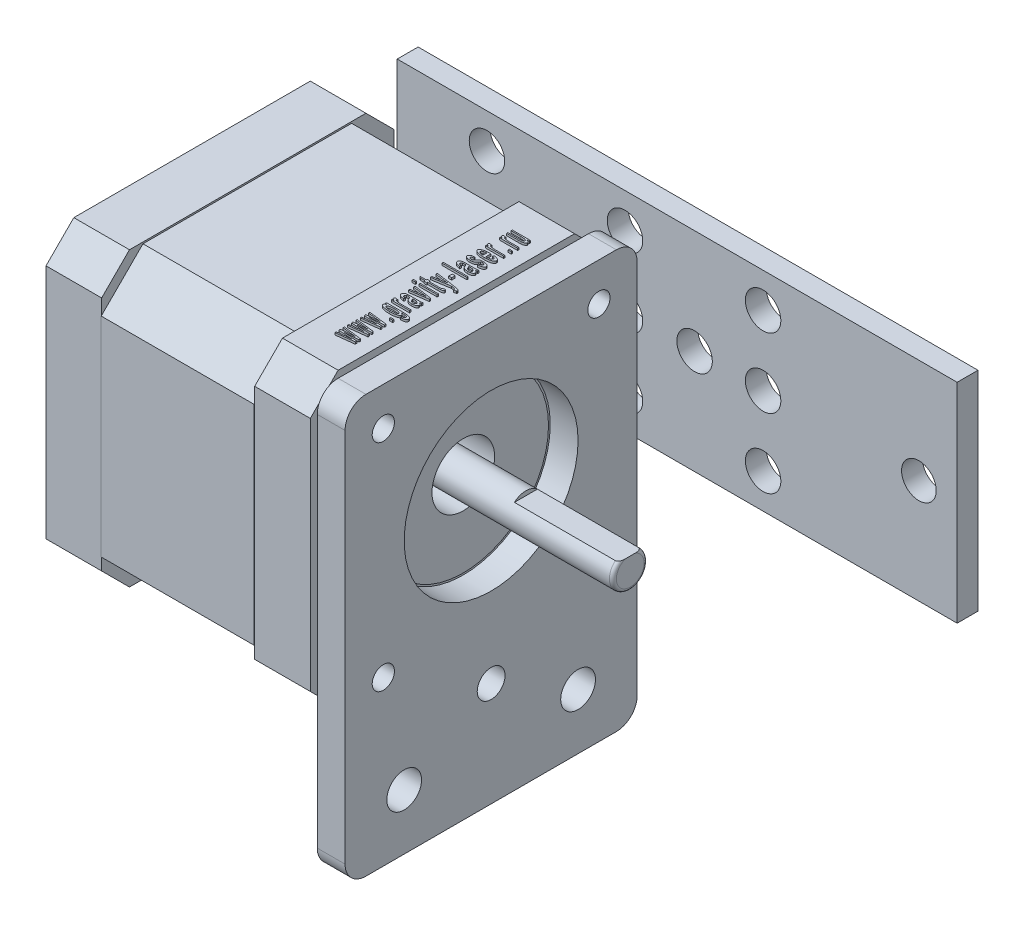
from build123d import *
from build123d.topology import SkipClean

# Parameters (mm, degrees)
SKETCH_1_R               = 12.5
SKETCH_1_R_2             = 1.6
SKETCH_1_R_3             = 2.5
EXTRUDE_1_DEPTH          = 4
SKETCH_2_W               = 65.5
SKETCH_2_H               = 30
SKETCH_2_R               = 2.55
EXTRUDE_2_DEPTH          = 3
SKETCH_3_W               = 15
SKETCH_3_H               = 30
EXTRUDE_3_DEPTH          = 3
SKETCH_4_R               = 2.492284787
CUT_EXTRUDE_1_DEPTH      = 10
CUT_EXTRUDE_2_DEPTH      = 10
CUT_EXTRUDE_2_DEPTH_BACK = 10
SKETCH_5_R               = 2
EXTRUDE_4_DEPTH          = 8
EXTRUDE_5_DEPTH          = 22
EXTRUDE_6_DEPTH          = 8
SKETCH_9_R               = 4.5
CUT_EXTRUDE_3_DEPTH      = 88
SKETCH_10_R              = 12.25
SKETCH_10_R_2            = 4.5
EXTRUDE_7_DEPTH          = 1
SKETCH_11_R              = 4
SKETCH_11_R_2            = 2.5
EXTRUDE_8_DEPTH          = 30
SKETCH_12_R              = 2.495
EXTRUDE_9_DEPTH          = 59
FILLET_1_R               = 0.5
CUT_EXTRUDE_4_DEPTH      = 55
CUT_EXTRUDE_4_DEPTH_BACK = 55
SKETCH_14_W              = 16.658255058
SKETCH_14_H              = 5.325088345
CUT_EXTRUDE_START        = -5
SKETCH_1_3_R             = 1.6
CUT_EXTRUDE_5_DEPTH      = 5
EXTRUDE_10_DEPTH         = 0.3
EXTRUDE_10_DEPTH_BACK    = 1
SKETCH_15_W              = 0.460980277
SKETCH_15_H              = 0.18439211
SKETCH_15_H_2            = 0.184392111
SKETCH_15_W_2            = 2.627587578
SKETCH_15_W_3            = 0.414882249
SKETCH_15_H_3            = 0.507078304
SKETCH_15_W_4            = 3.595646159


with BuildPart() as part:
    # Эскиз1 → Бобышка-Вытянуть1 (new body)
    with BuildSketch(Plane(origin=(0, 0, 0), x_dir=(0, 0, -1), z_dir=(1, 0, 0))):
        with BuildLine():
            Line((3, 0), (39, 0))
            ThreePointArc((39, 0), (41.121320344, 0.878679656), (42, 3))
            Line((42, 3), (42, 57))
            ThreePointArc((42, 57), (41.121320344, 59.121320344), (39, 60))
            Line((39, 60), (3, 60))
            ThreePointArc((3, 60), (0.878679656, 59.121320344), (0, 57))
            Line((0, 57), (0, 3))
            ThreePointArc((0, 3), (0.878679656, 0.878679656), (3, 0))
        make_face()
        with Locations((21, 39)):
            Circle(SKETCH_1_R, mode=Mode.SUBTRACT)
        with Locations((5.5, 54.5)):
            Circle(SKETCH_1_R_2, mode=Mode.SUBTRACT)
        with Locations((5.5, 23.5)):
            Circle(SKETCH_1_R_2, mode=Mode.SUBTRACT)
        with Locations((36.5, 23.5)):
            Circle(SKETCH_1_R_2, mode=Mode.SUBTRACT)
        with Locations((36.5, 54.5)):
            Circle(SKETCH_1_R_2, mode=Mode.SUBTRACT)
        with Locations((8.5, 8)):
            Circle(SKETCH_1_R_3, mode=Mode.SUBTRACT)
        with Locations((33.5, 8)):
            Circle(SKETCH_1_R_3, mode=Mode.SUBTRACT)
    extrude(amount=EXTRUDE_1_DEPTH)

    # Эскиз5 → Вырез-Вытянуть2 (cut, two sides: drawn at the far end of the back side and taken through both)
    with BuildSketch(Plane(origin=(4, 0, 0), x_dir=(0, 0, -1), z_dir=(1, 0, 0)).offset(-CUT_EXTRUDE_2_DEPTH_BACK)):
        with Locations((21, 15)):
            Circle(SKETCH_5_R)
    extrude(amount=CUT_EXTRUDE_2_DEPTH + CUT_EXTRUDE_2_DEPTH_BACK, mode=Mode.SUBTRACT)


with BuildPart() as body_2:
    # Эскиз2 → Бобышка-Вытянуть2 (new body)
    with BuildSketch(Plane.XY.offset(-80)):
        with Locations((-32.75, 15)):
            Rectangle(SKETCH_2_W, SKETCH_2_H)
        with Locations((-22.75, 15)):
            Circle(SKETCH_2_R, mode=Mode.SUBTRACT)
        with Locations((-12.9, 5)):
            Circle(SKETCH_2_R, mode=Mode.SUBTRACT)
        with Locations((-12.9, 15)):
            Circle(SKETCH_2_R, mode=Mode.SUBTRACT)
        with Locations((-12.9, 25)):
            Circle(SKETCH_2_R, mode=Mode.SUBTRACT)
        with Locations((-42.75, 15)):
            Circle(SKETCH_2_R, mode=Mode.SUBTRACT)
        with Locations((-52.6, 15)):
            Circle(SKETCH_2_R, mode=Mode.SUBTRACT)
        with Locations((-52.6, 25)):
            Circle(SKETCH_2_R, mode=Mode.SUBTRACT)
        with Locations((-52.6, 5)):
            Circle(SKETCH_2_R, mode=Mode.SUBTRACT)
        with Locations((-32.75, 15)):
            Circle(SKETCH_2_R, mode=Mode.SUBTRACT)
        with Locations((-32.75, 25)):
            Circle(SKETCH_2_R, mode=Mode.SUBTRACT)
        with Locations((-32.75, 5)):
            Circle(SKETCH_2_R, mode=Mode.SUBTRACT)
    extrude(amount=EXTRUDE_2_DEPTH)

    # Эскиз3 → Бобышка-Вытянуть3 (add)
    with BuildSketch(Plane.XY.offset(-80)):
        with Locations((7.5, 15)):
            Rectangle(SKETCH_3_W, SKETCH_3_H)
    extrude(amount=EXTRUDE_3_DEPTH)

    # Эскиз4 → Вырез-Вытянуть1 (cut)
    with BuildSketch(Plane(origin=(0, 0, -80), x_dir=(-1, 0, 0), z_dir=(0, 0, -1))):
        with Locations((-9.5, 15)):
            Circle(SKETCH_4_R)
    extrude(amount=-CUT_EXTRUDE_1_DEPTH, mode=Mode.SUBTRACT)


with BuildPart() as body_3:
    # Эскиз6 → Бобышка-Вытянуть4 (new body)
    with BuildSketch(Plane.ZY.offset(1)):
        Polygon((-42, 56), (-38, 60), (-4, 60), (0, 56), (0, 22), (-4, 18), (-38, 18), (-42, 22), align=None)
    extrude(amount=EXTRUDE_4_DEPTH)

    # Эскиз7 → Бобышка-Вытянуть5 (add)
    with BuildSketch(Plane.ZY.offset(9)):
        Polygon((-41.940436671, 53.772364763), (-35.940436671, 59.772364763), (-5.940436671, 59.772364763), (0.059563329, 53.772364763), (0.059563329, 23.772364763), (-5.940436671, 17.772364763), (-35.940436671, 17.772364763), (-41.940436671, 23.772364763), align=None)
    extrude(amount=EXTRUDE_5_DEPTH)

    # Эскиз8 → Бобышка-Вытянуть6 (add)
    with BuildSketch(Plane.ZY.offset(31)):
        Polygon((-42, 56), (-38, 60), (-4, 60), (0, 56), (0, 22), (-4, 18), (-38, 18), (-42, 22), align=None)
    extrude(amount=EXTRUDE_6_DEPTH)

    # Эскиз9 → Вырез-Вытянуть3 (cut)
    with BuildSketch(Plane.ZY.offset(39)):
        with Locations((-21, 39)):
            Circle(SKETCH_9_R)
    extrude(amount=-CUT_EXTRUDE_3_DEPTH, mode=Mode.SUBTRACT)

    # Эскиз10 → Бобышка-Вытянуть7 (add)
    with SkipClean():  # the faces are left unmerged after this step: merging them gives an invalid solid
        with BuildSketch(Plane(origin=(-1, 0, 0), x_dir=(0, 0, -1), z_dir=(1, 0, 0))):
            with Locations((21, 39)):
                Circle(SKETCH_10_R)
            with Locations((21, 39)):
                Circle(SKETCH_10_R_2, mode=Mode.SUBTRACT)
        extrude(amount=EXTRUDE_7_DEPTH)

    # Эскиз1<3> → Вырез-Вытянуть5 (cut)
    with SkipClean():  # the faces are left unmerged after this step: merging them gives an invalid solid
        with BuildSketch(Plane(origin=(0, 0, 0), x_dir=(0, 0, -1), z_dir=(1, 0, 0)).offset(CUT_EXTRUDE_START)):
            with Locations((5.5, 54.5)):
                Circle(SKETCH_1_3_R)
            with Locations((5.5, 23.5)):
                Circle(SKETCH_1_3_R)
            with Locations((36.5, 23.5)):
                Circle(SKETCH_1_3_R)
            with Locations((36.5, 54.5)):
                Circle(SKETCH_1_3_R)
        extrude(amount=CUT_EXTRUDE_5_DEPTH, mode=Mode.SUBTRACT)

    # Эскиз15 → Бобышка-Вытянуть10 (add, two sides: drawn at the far end of the back side and taken through both)
    # profile 1 of 21: a face of its own
    with SkipClean():  # the faces are left unmerged after this step: merging them gives an invalid solid
        with BuildSketch(Plane(origin=(0, 60, 0), x_dir=(1, 0, 0), z_dir=(0, 1, 0)).offset(-EXTRUDE_10_DEPTH_BACK)):
            with BuildLine():
                Line((-3, 8.467386838), (-5.627587578, 8.154784588))
                Line((-5.627587578, 8.154784588), (-5.627587578, 8.347820079))
                Line((-5.627587578, 8.347820079), (-4.090506467, 8.519967401))
                Line((-4.090506467, 8.519967401), (-3.546693797, 8.56678571))
                add(Edge.make_bspline(
                    [(-3.546693797, 8.56678571), (-3.552455013, 8.567279252), (-3.568527755, 8.568656145), (-3.599509703, 8.570706108), (-3.644429203, 8.573492821), (-3.70325396, 8.577825589), (-3.775934737, 8.584018128), (-3.862445283, 8.589196351), (-3.962787375, 8.596652947), (-4.034325271, 8.602069989), (-4.072499425, 8.604960639)],
                    knots=[0, 0, 0, 0, 0.263229435, 0.734362201, 1.413431517, 2.312088188, 3.41947649, 4.733988812, 6.257186419, 8, 8, 8, 8], degree=3))
                Line((-4.072499425, 8.604960639), (-5.627587578, 8.738933032))
                Line((-5.627587578, 8.738933032), (-5.627587578, 8.9564581))
                Line((-5.627587578, 8.9564581), (-4.080422524, 9.08898993))
                Line((-4.080422524, 9.08898993), (-3.601435205, 9.122843169))
                Line((-3.601435205, 9.122843169), (-4.096268721, 9.172542605))
                Line((-4.096268721, 9.172542605), (-5.627587578, 9.345410209))
                Line((-5.627587578, 9.345410209), (-5.627587578, 9.537725418))
                Line((-5.627587578, 9.537725418), (-3, 9.220801478))
                Line((-3, 9.220801478), (-3, 9.01191979))
                Line((-3, 9.01191979), (-4.542843364, 8.87938796))
                Line((-4.542843364, 8.87938796), (-5.021110401, 8.846255003))
                Line((-5.021110401, 8.846255003), (-3, 8.679149652))
                Line((-3, 8.679149652), (-3, 8.467386838))
            make_face()
        # profile 2 of 21: a face of its own
        with BuildSketch(Plane(origin=(0, 60, 0), x_dir=(1, 0, 0), z_dir=(0, 1, 0)).offset(-EXTRUDE_10_DEPTH_BACK)):
            with BuildLine():
                Line((-3, 10.297478537), (-5.627587578, 9.984876286))
                Line((-5.627587578, 9.984876286), (-5.627587578, 10.177911777))
                Line((-5.627587578, 10.177911777), (-4.090506467, 10.350059099))
                Line((-4.090506467, 10.350059099), (-3.546693797, 10.396877409))
                add(Edge.make_bspline(
                    [(-3.546693797, 10.396877409), (-3.552455013, 10.397370951), (-3.568527755, 10.398747844), (-3.599509703, 10.400797807), (-3.644429203, 10.40358452), (-3.70325396, 10.407917288), (-3.775934737, 10.414109827), (-3.862445283, 10.41928805), (-3.962787375, 10.426744646), (-4.034325271, 10.432161688), (-4.072499425, 10.435052338)],
                    knots=[0, 0, 0, 0, 0.263229435, 0.734362201, 1.413431517, 2.312088188, 3.41947649, 4.733988812, 6.257186419, 8, 8, 8, 8], degree=3))
                Line((-4.072499425, 10.435052338), (-5.627587578, 10.569024731))
                Line((-5.627587578, 10.569024731), (-5.627587578, 10.786549799))
                Line((-5.627587578, 10.786549799), (-4.080422524, 10.919081629))
                Line((-4.080422524, 10.919081629), (-3.601435205, 10.952934868))
                Line((-3.601435205, 10.952934868), (-4.096268721, 11.002634304))
                Line((-4.096268721, 11.002634304), (-5.627587578, 11.175501908))
                Line((-5.627587578, 11.175501908), (-5.627587578, 11.367817117))
                Line((-5.627587578, 11.367817117), (-3, 11.050893176))
                Line((-3, 11.050893176), (-3, 10.842011489))
                Line((-3, 10.842011489), (-4.542843364, 10.709479659))
                Line((-4.542843364, 10.709479659), (-5.021110401, 10.676346702))
                Line((-5.021110401, 10.676346702), (-3, 10.509241351))
                Line((-3, 10.509241351), (-3, 10.297478537))
            make_face()
        # profile 3 of 21: a face of its own
        with BuildSketch(Plane(origin=(0, 60, 0), x_dir=(1, 0, 0), z_dir=(0, 1, 0)).offset(-EXTRUDE_10_DEPTH_BACK)):
            with BuildLine():
                Line((-3, 12.127570235), (-5.627587578, 11.814967985))
                Line((-5.627587578, 11.814967985), (-5.627587578, 12.008003476))
                Line((-5.627587578, 12.008003476), (-4.090506467, 12.180150798))
                Line((-4.090506467, 12.180150798), (-3.546693797, 12.226969108))
                add(Edge.make_bspline(
                    [(-3.546693797, 12.226969108), (-3.552455013, 12.22746265), (-3.568527755, 12.228839543), (-3.599509703, 12.230889505), (-3.644429203, 12.233676219), (-3.70325396, 12.238008987), (-3.775934737, 12.244201526), (-3.862445283, 12.249379749), (-3.962787375, 12.256836345), (-4.034325271, 12.262253387), (-4.072499425, 12.265144037)],
                    knots=[0, 0, 0, 0, 0.263229435, 0.734362201, 1.413431517, 2.312088188, 3.41947649, 4.733988812, 6.257186419, 8, 8, 8, 8], degree=3))
                Line((-4.072499425, 12.265144037), (-5.627587578, 12.39911643))
                Line((-5.627587578, 12.39911643), (-5.627587578, 12.616641498))
                Line((-5.627587578, 12.616641498), (-4.080422524, 12.749173327))
                Line((-4.080422524, 12.749173327), (-3.601435205, 12.783026566))
                Line((-3.601435205, 12.783026566), (-4.096268721, 12.832726003))
                Line((-4.096268721, 12.832726003), (-5.627587578, 13.005593606))
                Line((-5.627587578, 13.005593606), (-5.627587578, 13.197908816))
                Line((-5.627587578, 13.197908816), (-3, 12.880984875))
                Line((-3, 12.880984875), (-3, 12.672103187))
                Line((-3, 12.672103187), (-4.542843364, 12.539571358))
                Line((-4.542843364, 12.539571358), (-5.021110401, 12.5064384))
                Line((-5.021110401, 12.5064384), (-3, 12.33933305))
                Line((-3, 12.33933305), (-3, 12.127570235))
            make_face()
        # profile 4 of 21: a face of its own
        with BuildSketch(Plane(origin=(0, 60, 0), x_dir=(1, 0, 0), z_dir=(0, 1, 0)).offset(-EXTRUDE_10_DEPTH_BACK)):
            with Locations((-3.230490138, 13.944696864)):
                Rectangle(SKETCH_15_W, SKETCH_15_H)
        # profile 5 of 21: a face of its own
        with BuildSketch(Plane(origin=(0, 60, 0), x_dir=(1, 0, 0), z_dir=(0, 1, 0)).offset(-EXTRUDE_10_DEPTH_BACK)):
            with BuildLine():
                Line((-2.815607889, 14.760631954), (-2.769509862, 14.945024065))
                add(Edge.make_bspline(
                    [(-2.769509862, 14.945024065), (-2.741829615, 14.946632284), (-2.690084669, 14.949638661), (-2.619328691, 14.961843459), (-2.559340672, 14.974533772), (-2.52563274, 14.989867736), (-2.510208456, 14.996884346)],
                    knots=[0, 0, 0, 0, 1.248889373, 2.334650867, 3.237959222, 4, 4, 4, 4], degree=3))
                add(Edge.make_bspline(
                    [(-2.510208456, 14.996884346), (-2.493448031, 15.006340979), (-2.462086645, 15.024035825), (-2.427382189, 15.062349713), (-2.403749007, 15.105143313), (-2.401742036, 15.136556516), (-2.40072564, 15.152465189)],
                    knots=[0, 0, 0, 0, 1.14327361, 2.139244396, 3.057652518, 4, 4, 4, 4], degree=3))
                add(Edge.make_bspline(
                    [(-2.40072564, 15.152465189), (-2.401726196, 15.169546158), (-2.403684299, 15.202973894), (-2.426815464, 15.248776213), (-2.461916078, 15.288512772), (-2.512089424, 15.319351673), (-2.57264372, 15.34550975), (-2.64452182, 15.366958599), (-2.726981514, 15.383873048), (-2.786011666, 15.391296844), (-2.817048453, 15.395200116)],
                    knots=[0, 0, 0, 0, 0.772256192, 1.511318016, 2.286437148, 3.163518131, 4.167875067, 5.289326539, 6.574786063, 8, 8, 8, 8], degree=3))
                add(Edge.make_bspline(
                    [(-2.817048453, 15.395200116), (-2.828326806, 15.396248969), (-2.853730321, 15.398611419), (-2.896279037, 15.400306672), (-2.947158581, 15.402730937), (-3.006236833, 15.404030275), (-3.073468483, 15.404570492), (-3.149098049, 15.405296698), (-3.233129294, 15.406209459), (-3.291953883, 15.40607473), (-3.322686194, 15.406004341)],
                    knots=[0, 0, 0, 0, 0.537282225, 1.210181683, 2.019618873, 2.953906197, 4.01327095, 5.209313029, 6.54203387, 8, 8, 8, 8], degree=3))
                add(Edge.make_bspline(
                    [(-3.322686194, 15.406004341), (-3.297335313, 15.396999531), (-3.249394565, 15.379970641), (-3.183636096, 15.350398623), (-3.127444702, 15.319801932), (-3.081642306, 15.28667223), (-3.045468042, 15.25203627), (-3.019260478, 15.215391395), (-3.002994368, 15.176313632), (-3.000988818, 15.14924477), (-3, 15.13589871)],
                    knots=[0, 0, 0, 0, 1.44505194, 2.732720478, 3.87051748, 4.876895417, 5.761828904, 6.549226263, 7.284709022, 8, 8, 8, 8], degree=3))
                add(Edge.make_bspline(
                    [(-3, 15.13589871), (-3.0009684, 15.119368784), (-3.002913838, 15.086161496), (-3.023564995, 15.039049107), (-3.054269123, 14.994816076), (-3.098788597, 14.955219323), (-3.153538101, 14.916821765), (-3.221378926, 14.88298708), (-3.300568145, 14.851062044), (-3.390968909, 14.823464595), (-3.489484232, 14.797721738), (-3.594045893, 14.775421567), (-3.703698338, 14.757062367), (-3.817939976, 14.740797024), (-3.937205077, 14.729786117), (-4.061123163, 14.721211145), (-4.189842045, 14.714941926), (-4.2772918, 14.71467137), (-4.321716887, 14.714533926)],
                    knots=[0, 0, 0, 0, 0.535056287, 1.074884884, 1.647219554, 2.277541893, 3.001604, 3.81945128, 4.738021896, 5.778535566, 6.893038315, 8.051759058, 9.256827172, 10.511182975, 11.806636795, 13.154011892, 14.554218126, 16, 16, 16, 16], degree=3))
                add(Edge.make_bspline(
                    [(-4.321716887, 14.714533926), (-4.382954608, 14.714995636), (-4.503104092, 14.715901519), (-4.679433263, 14.725695542), (-4.848640677, 14.740446735), (-5.008721119, 14.761741124), (-5.156551672, 14.788166301), (-5.288348274, 14.820978525), (-5.402304535, 14.859243467), (-5.485099529, 14.89665526), (-5.541232988, 14.929468261), (-5.576782216, 14.95439552), (-5.606154856, 14.981098605), (-5.630750367, 15.008071577), (-5.649713864, 15.036462594), (-5.66363302, 15.066003052), (-5.67183405, 15.09681127), (-5.673069518, 15.117605982), (-5.673685605, 15.127975612)],
                    knots=[0, 0, 0, 0, 1.960309252, 3.846161164, 5.652040472, 7.396817701, 9.01451974, 10.457461939, 11.740907255, 12.858631906, 13.358257113, 13.821112033, 14.24561517, 14.626700231, 14.986985092, 15.334328333, 15.668051735, 16, 16, 16, 16], degree=3))
                add(Edge.make_bspline(
                    [(-5.673685605, 15.127975612), (-5.672541694, 15.141836112), (-5.670205186, 15.170147009), (-5.651416157, 15.210840517), (-5.621354389, 15.248774395), (-5.580481191, 15.284990359), (-5.52720758, 15.317561431), (-5.46384303, 15.350076166), (-5.388520786, 15.380116108), (-5.333846404, 15.397043079), (-5.304901384, 15.406004341)],
                    knots=[0, 0, 0, 0, 0.676302955, 1.381389014, 2.152233373, 3.034329793, 4.03823336, 5.199563299, 6.517428189, 8, 8, 8, 8], degree=3))
                Line((-5.304901384, 15.406004341), (-5.627587578, 15.406004341))
                Line((-5.627587578, 15.406004341), (-5.627587578, 15.590396452))
                Line((-5.627587578, 15.590396452), (-3.388231827, 15.590396452))
                add(Edge.make_bspline(
                    [(-3.388231827, 15.590396452), (-3.339731914, 15.590270044), (-3.246328341, 15.590026602), (-3.111626054, 15.58785102), (-2.987719476, 15.584377383), (-2.874866208, 15.579311848), (-2.773214482, 15.573368334), (-2.682760663, 15.564221027), (-2.603157512, 15.55545476), (-2.51346797, 15.541347566), (-2.414678467, 15.519234771), (-2.307505968, 15.48686024), (-2.21354601, 15.446522889), (-2.133565762, 15.399538542), (-2.067821562, 15.346935022), (-2.0207789, 15.28637224), (-1.99117675, 15.219313583), (-1.987628189, 15.171960424), (-1.985843391, 15.148143499)],
                    knots=[0, 0, 0, 0, 1.466719357, 2.824681989, 4.074084006, 5.215177491, 6.241047558, 7.152832486, 7.964300773, 8.662631576, 9.897518001, 11.022840065, 12.043945386, 12.981613822, 13.822029434, 14.572856839, 15.282198632, 16, 16, 16, 16], degree=3))
                add(Edge.make_bspline(
                    [(-1.985843391, 15.148143499), (-1.986212522, 15.133655899), (-1.986935991, 15.105261257), (-1.99820183, 15.064230292), (-2.013352632, 15.024747053), (-2.037600285, 14.988627946), (-2.06636145, 14.953650775), (-2.102250423, 14.92094784), (-2.144954683, 14.891175468), (-2.193426057, 14.862827913), (-2.248568476, 14.837484641), (-2.310449827, 14.816361267), (-2.378772673, 14.798138647), (-2.453502268, 14.784348402), (-2.534671039, 14.772512254), (-2.622444624, 14.764936208), (-2.716881974, 14.76052594), (-2.781989584, 14.760595854), (-2.815607889, 14.760631954)],
                    knots=[0, 0, 0, 0, 0.687635845, 1.347716178, 2.014498006, 2.693329913, 3.407824925, 4.16858901, 4.996754335, 5.883260036, 6.840067018, 7.881613529, 8.993890174, 10.204943585, 11.498690364, 12.899445736, 14.399029199, 16, 16, 16, 16], degree=3))
            make_face()
            with BuildLine():
                add(Edge.make_bspline(
                    [(-4.353409281, 14.898926037), (-4.314033713, 14.899328928), (-4.237913801, 14.900107787), (-4.12789133, 14.902486186), (-4.026308923, 14.908412576), (-3.93309051, 14.916149168), (-3.848058117, 14.926257441), (-3.770971805, 14.937867493), (-3.702418679, 14.95346491), (-3.64151964, 14.969353106), (-3.588732766, 14.988726037), (-3.542509779, 15.00736677), (-3.503730034, 15.028573132), (-3.471863096, 15.050592193), (-3.446641319, 15.073970797), (-3.428020175, 15.098263837), (-3.417139923, 15.124738376), (-3.415632397, 15.142771558), (-3.414882249, 15.151744907)],
                    knots=[0, 0, 0, 0, 1.842274345, 3.56144094, 5.147776956, 6.602033686, 7.936770111, 9.153727065, 10.246579223, 11.224842964, 12.095274606, 12.875512112, 13.554128895, 14.158706996, 14.683159799, 15.157194488, 15.580618227, 16, 16, 16, 16], degree=3))
                add(Edge.make_bspline(
                    [(-3.414882249, 15.151744907), (-3.415632491, 15.160718164), (-3.417140207, 15.178751162), (-3.428018969, 15.205227153), (-3.446646681, 15.229513792), (-3.471593454, 15.252692337), (-3.503441329, 15.274574411), (-3.542387283, 15.294858438), (-3.58793507, 15.315269507), (-3.640773378, 15.333691961), (-3.700804713, 15.35107393), (-3.768604358, 15.366216364), (-3.844497429, 15.377780364), (-3.927983649, 15.38905984), (-4.01959612, 15.396409366), (-4.119003499, 15.402460058), (-4.226389776, 15.404819037), (-4.300588713, 15.405600009), (-4.339003648, 15.406004341)],
                    knots=[0, 0, 0, 0, 0.425210039, 0.854518218, 1.3351407, 1.866881972, 2.46399905, 3.162058998, 3.947215136, 4.829743412, 5.813725128, 6.910647518, 8.122026991, 9.45410925, 10.905882552, 12.480154436, 14.177674165, 16, 16, 16, 16], degree=3))
                add(Edge.make_bspline(
                    [(-4.339003648, 15.406004341), (-4.375981311, 15.405697178), (-4.447313461, 15.405104642), (-4.551063183, 15.401431521), (-4.64761897, 15.395805488), (-4.737513202, 15.388129351), (-4.819928413, 15.377417591), (-4.895574566, 15.364241599), (-4.964350692, 15.349871104), (-5.025729877, 15.331538978), (-5.079838083, 15.312262869), (-5.126919133, 15.291934588), (-5.167533003, 15.271770086), (-5.200285461, 15.249224762), (-5.226108733, 15.226221132), (-5.244929831, 15.20205429), (-5.256604174, 15.176249983), (-5.258081766, 15.158333615), (-5.258803356, 15.149584062)],
                    knots=[0, 0, 0, 0, 1.764361063, 3.403559276, 4.95282211, 6.378935111, 7.707525984, 8.916655208, 10.04242927, 11.057426719, 11.970601119, 12.781385994, 13.503836198, 14.129837194, 14.673118611, 15.147399398, 15.583627986, 16, 16, 16, 16], degree=3))
                add(Edge.make_bspline(
                    [(-5.258803356, 15.149584062), (-5.258116197, 15.140820804), (-5.256726446, 15.123097483), (-5.244707532, 15.097691646), (-5.226340244, 15.073944044), (-5.200936798, 15.051099092), (-5.168260933, 15.030108147), (-5.128863963, 15.008920202), (-5.082263077, 14.989182011), (-5.028594772, 14.970533751), (-4.968151034, 14.952973735), (-4.900304104, 14.939393562), (-4.825993777, 14.925860809), (-4.744653013, 14.9163414), (-4.656511461, 14.908405551), (-4.561641909, 14.902535516), (-4.459783038, 14.900098371), (-4.389663975, 14.899325596), (-4.353409281, 14.898926037)],
                    knots=[0, 0, 0, 0, 0.423175551, 0.855854733, 1.337885288, 1.873595085, 2.503292768, 3.216950142, 4.040983278, 4.954207292, 5.971365108, 7.090316246, 8.307731766, 9.633462793, 11.059684886, 12.599395956, 14.241735538, 16, 16, 16, 16], degree=3))
            make_face(mode=Mode.SUBTRACT)
        # profile 6 of 21: a face of its own
        with BuildSketch(Plane(origin=(0, 60, 0), x_dir=(1, 0, 0), z_dir=(0, 1, 0)).offset(-EXTRUDE_10_DEPTH_BACK)):
            with BuildLine():
                Line((-3, 16.268037459), (-5.627587578, 16.268037459))
                Line((-5.627587578, 16.268037459), (-5.627587578, 16.406331542))
                Line((-5.627587578, 16.406331542), (-5.260964201, 16.406331542))
                add(Edge.make_bspline(
                    [(-5.260964201, 16.406331542), (-5.299496475, 16.415999502), (-5.369780626, 16.433634182), (-5.46369398, 16.463238466), (-5.536894286, 16.490318229), (-5.590556377, 16.517307856), (-5.628672456, 16.544825997), (-5.653234469, 16.574208105), (-5.670802826, 16.604089616), (-5.672736382, 16.625560761), (-5.673685605, 16.636101399)],
                    knots=[0, 0, 0, 0, 1.910431729, 3.484691049, 4.735072694, 5.659708583, 6.368816618, 6.975107921, 7.496858853, 8, 8, 8, 8], degree=3))
                add(Edge.make_bspline(
                    [(-5.673685605, 16.636101399), (-5.671986153, 16.651732978), (-5.668414112, 16.684588637), (-5.642590619, 16.731784129), (-5.603265228, 16.77863875), (-5.569108497, 16.806208136), (-5.550517438, 16.821213791)],
                    knots=[0, 0, 0, 0, 0.814693589, 1.712385845, 2.754881707, 4, 4, 4, 4], degree=3))
                Line((-5.550517438, 16.821213791), (-5.142117724, 16.762150693))
                add(Edge.make_bspline(
                    [(-5.142117724, 16.762150693), (-5.159553245, 16.752356399), (-5.190704969, 16.734857115), (-5.227936387, 16.704216458), (-5.253755533, 16.673093334), (-5.257226274, 16.649639705), (-5.258803356, 16.638982525)],
                    knots=[0, 0, 0, 0, 1.352648312, 2.416751838, 3.280582159, 4, 4, 4, 4], degree=3))
                add(Edge.make_bspline(
                    [(-5.258803356, 16.638982525), (-5.257566511, 16.629847128), (-5.254961285, 16.610604803), (-5.235765999, 16.584554627), (-5.207819924, 16.55982007), (-5.168091724, 16.53829586), (-5.119287828, 16.518470248), (-5.061396344, 16.501346173), (-4.994880964, 16.487771942), (-4.947455622, 16.482082176), (-4.92243181, 16.479079992)],
                    knots=[0, 0, 0, 0, 0.551688631, 1.162048167, 1.90516588, 2.812607804, 3.884347412, 5.101581694, 6.470660024, 8, 8, 8, 8], degree=3))
                add(Edge.make_bspline(
                    [(-4.92243181, 16.479079992), (-4.881394668, 16.475018502), (-4.797491331, 16.466714498), (-4.668750837, 16.458230015), (-4.53424384, 16.453043943), (-4.442729149, 16.452637517), (-4.395905901, 16.45242957)],
                    knots=[0, 0, 0, 0, 0.938135227, 1.918083781, 2.934793096, 4, 4, 4, 4], degree=3))
                Line((-4.395905901, 16.45242957), (-3, 16.45242957))
                Line((-3, 16.45242957), (-3, 16.268037459))
            make_face()
        # profile 7 of 21: a face of its own
        with BuildSketch(Plane(origin=(0, 60, 0), x_dir=(1, 0, 0), z_dir=(0, 1, 0)).offset(-EXTRUDE_10_DEPTH_BACK)):
            with BuildLine():
                add(Edge.make_bspline(
                    [(-3.322686194, 17.959835075), (-3.29133679, 17.946724676), (-3.232649857, 17.922181656), (-3.152517263, 17.882897446), (-3.088702824, 17.840019387), (-3.038048605, 17.797192359), (-3.000318327, 17.752531044), (-2.973694512, 17.706228483), (-2.956676867, 17.658002734), (-2.954821508, 17.624795488), (-2.953901972, 17.608337614)],
                    knots=[0, 0, 0, 0, 1.507922519, 2.822871786, 3.951541029, 4.910610408, 5.757644248, 6.530632161, 7.271765238, 8, 8, 8, 8], degree=3))
                add(Edge.make_bspline(
                    [(-2.953901972, 17.608337614), (-2.954700266, 17.595085961), (-2.956273342, 17.568972917), (-2.965644167, 17.530682445), (-2.982612343, 17.495333887), (-3.005651233, 17.462014661), (-3.035041747, 17.431040721), (-3.072235795, 17.403857835), (-3.114564696, 17.377647051), (-3.181951516, 17.3468084), (-3.277359335, 17.314797193), (-3.404467556, 17.28791093), (-3.545785885, 17.271478023), (-3.644845034, 17.269431886), (-3.696512387, 17.268364659)],
                    knots=[0, 0, 0, 0, 0.534682444, 1.053618465, 1.57767702, 2.106719939, 2.681939118, 3.289954347, 3.959104568, 4.686705671, 6.272652826, 8.006411766, 9.91702094, 12, 12, 12, 12], degree=3))
                add(Edge.make_bspline(
                    [(-3.696512387, 17.268364659), (-3.727739362, 17.268729633), (-3.788582961, 17.269440759), (-3.877952984, 17.276448592), (-3.963146179, 17.285967245), (-4.043696904, 17.300387664), (-4.117910389, 17.318300594), (-4.185443244, 17.338210576), (-4.244990784, 17.360976878), (-4.297215374, 17.386327963), (-4.341933151, 17.414719361), (-4.381036344, 17.444246998), (-4.415031703, 17.475099949), (-4.433176061, 17.49834802), (-4.442003928, 17.509659023)],
                    knots=[0, 0, 0, 0, 1.389708388, 2.707750614, 3.988300692, 5.204203801, 6.347336663, 7.385318213, 8.336000275, 9.181979917, 9.964777687, 10.689383759, 11.362339206, 12, 12, 12, 12], degree=3))
                add(Edge.make_bspline(
                    [(-4.442003928, 17.509659023), (-4.447967338, 17.518909474), (-4.460744906, 17.538730058), (-4.476926275, 17.57330122), (-4.493704524, 17.613532755), (-4.503216321, 17.643066401), (-4.508269843, 17.658757331)],
                    knots=[0, 0, 0, 0, 0.805930126, 1.726835266, 2.792290395, 4, 4, 4, 4], degree=3))
                add(Edge.make_bspline(
                    [(-4.508269843, 17.658757331), (-4.518811071, 17.690639429), (-4.538739556, 17.750913423), (-4.574580967, 17.833345213), (-4.613372784, 17.902974703), (-4.64483391, 17.941241068), (-4.659528996, 17.959114793)],
                    knots=[0, 0, 0, 0, 1.189020977, 2.247877315, 3.181606128, 4, 4, 4, 4], degree=3))
                add(Edge.make_bspline(
                    [(-4.659528996, 17.959114793), (-4.672255304, 17.959000252), (-4.695309522, 17.958792756), (-4.726030068, 17.960019606), (-4.749084304, 17.959810556), (-4.761809076, 17.959828117), (-4.766850967, 17.959835075)],
                    knots=[0, 0, 0, 0, 1.422707779, 2.577292221, 3.436285597, 4, 4, 4, 4], degree=3))
                add(Edge.make_bspline(
                    [(-4.766850967, 17.959835075), (-4.80553331, 17.959340981), (-4.876748614, 17.958431341), (-4.974394862, 17.950652959), (-5.054442101, 17.938987217), (-5.099775641, 17.922969304), (-5.119788991, 17.915897892)],
                    knots=[0, 0, 0, 0, 1.297849472, 2.389378144, 3.288960443, 4, 4, 4, 4], degree=3))
                add(Edge.make_bspline(
                    [(-5.119788991, 17.915897892), (-5.140603216, 17.905874998), (-5.179561925, 17.887114799), (-5.225217644, 17.845248913), (-5.25432379, 17.794613921), (-5.257292396, 17.757565489), (-5.258803356, 17.738708598)],
                    knots=[0, 0, 0, 0, 1.152590404, 2.157343529, 3.062125739, 4, 4, 4, 4], degree=3))
                add(Edge.make_bspline(
                    [(-5.258803356, 17.738708598), (-5.257803705, 17.721498795), (-5.255873886, 17.688275386), (-5.23795402, 17.642260524), (-5.208309991, 17.603516206), (-5.165546975, 17.572446095), (-5.108279699, 17.548428108), (-5.03564271, 17.528148343), (-4.945684036, 17.51134005), (-4.879751551, 17.503250821), (-4.843921107, 17.498854798)],
                    knots=[0, 0, 0, 0, 0.776462873, 1.498956392, 2.196669391, 2.957382431, 3.862181403, 4.993689049, 6.366246057, 8, 8, 8, 8], degree=3))
                Line((-4.843921107, 17.498854798), (-4.890019135, 17.314462687))
                add(Edge.make_bspline(
                    [(-4.890019135, 17.314462687), (-4.933035055, 17.318419273), (-5.01493796, 17.325952667), (-5.130842628, 17.342317796), (-5.233764916, 17.362438906), (-5.32463818, 17.385576336), (-5.404026189, 17.414534525), (-5.473794542, 17.448385795), (-5.533723733, 17.48861524), (-5.584195004, 17.534302122), (-5.624579363, 17.584856688), (-5.65289829, 17.640254812), (-5.670425928, 17.699484647), (-5.672585757, 17.740268839), (-5.673685605, 17.76103733)],
                    knots=[0, 0, 0, 0, 1.568613024, 2.986660754, 4.248631518, 5.375876238, 6.388245767, 7.312401625, 8.185413601, 9.000089996, 9.776297159, 10.521115194, 11.246909057, 12, 12, 12, 12], degree=3))
                add(Edge.make_bspline(
                    [(-5.673685605, 17.76103733), (-5.672724032, 17.781291659), (-5.67086595, 17.820429791), (-5.656380143, 17.876206728), (-5.631346331, 17.925857597), (-5.596066807, 17.96838668), (-5.553573361, 18.004688005), (-5.507114499, 18.037769024), (-5.454138205, 18.063250828), (-5.396645524, 18.085320867), (-5.332282477, 18.102215624), (-5.261072103, 18.116430789), (-5.181976441, 18.128052147), (-5.126543247, 18.132992075), (-5.097460259, 18.135583805)],
                    knots=[0, 0, 0, 0, 0.954834083, 1.845058528, 2.696153148, 3.557737005, 4.432622258, 5.328164097, 6.240035035, 7.197285065, 8.230540111, 9.374648699, 10.622611235, 12, 12, 12, 12], degree=3))
                add(Edge.make_bspline(
                    [(-5.097460259, 18.135583805), (-5.075135688, 18.136870832), (-5.023551642, 18.139844688), (-4.935655848, 18.142546111), (-4.826637533, 18.143680073), (-4.746923372, 18.144034154), (-4.703466179, 18.144227185)],
                    knots=[0, 0, 0, 0, 0.680786621, 1.573052813, 2.676918775, 4, 4, 4, 4], degree=3))
                Line((-4.703466179, 18.144227185), (-4.140926185, 18.144227185))
                add(Edge.make_bspline(
                    [(-4.140926185, 18.144227185), (-4.093867616, 18.144157164), (-4.004071508, 18.14402355), (-3.875621997, 18.144926561), (-3.759657854, 18.145701569), (-3.656170101, 18.146083307), (-3.565181636, 18.147844341), (-3.486655593, 18.148905452), (-3.420636221, 18.151234654), (-3.318724704, 18.155189668), (-3.179476103, 18.164832071), (-3.058983193, 18.181947123), (-3, 18.190325213)],
                    knots=[0, 0, 0, 0, 1.235093393, 2.356777543, 3.371338114, 4.278775548, 5.072864175, 5.759842952, 6.33988881, 6.806582623, 8.436771468, 10, 10, 10, 10], degree=3))
                Line((-3, 18.190325213), (-3, 18.005933102))
                add(Edge.make_bspline(
                    [(-3, 18.005933102), (-3.023942523, 18.000083985), (-3.073432622, 17.987993639), (-3.151515024, 17.975742589), (-3.235074821, 17.965232589), (-3.292884382, 17.961671089), (-3.322686194, 17.959835075)],
                    knots=[0, 0, 0, 0, 0.905519738, 1.871743526, 2.902847589, 4, 4, 4, 4], degree=3))
            make_face()
            with BuildLine():
                add(Edge.make_bspline(
                    [(-4.244646747, 17.959835075), (-4.230745577, 17.943117817), (-4.201394883, 17.907821284), (-4.164301479, 17.844489416), (-4.129803139, 17.770458303), (-4.111119412, 17.716103946), (-4.101310692, 17.687568599)],
                    knots=[0, 0, 0, 0, 0.840882937, 1.775425805, 2.8321268, 4, 4, 4, 4], degree=3))
                add(Edge.make_bspline(
                    [(-4.101310692, 17.687568599), (-4.095848599, 17.67160366), (-4.085584486, 17.641603083), (-4.066706911, 17.601243407), (-4.047741797, 17.567773381), (-4.026771952, 17.541096073), (-4.002443253, 17.519717137), (-3.973208733, 17.502989244), (-3.939737297, 17.48765092), (-3.887742159, 17.470323295), (-3.814670338, 17.455756801), (-3.753973789, 17.453782434), (-3.722442528, 17.45275677)],
                    knots=[0, 0, 0, 0, 1.035083953, 1.945082058, 2.73123162, 3.391855107, 4.018560245, 4.706093149, 5.451390205, 6.276371761, 8.065611698, 10, 10, 10, 10], degree=3))
                add(Edge.make_bspline(
                    [(-3.722442528, 17.45275677), (-3.698139374, 17.453086794), (-3.651461384, 17.453720657), (-3.585054184, 17.464686408), (-3.524348785, 17.478807395), (-3.471310192, 17.501296684), (-3.426011293, 17.528140466), (-3.392322354, 17.563112595), (-3.372485427, 17.605320376), (-3.370030346, 17.635510592), (-3.368784221, 17.650834233)],
                    knots=[0, 0, 0, 0, 1.297980553, 2.492973756, 3.592380701, 4.622644034, 5.563214531, 6.389954162, 7.182789382, 8, 8, 8, 8], degree=3))
                add(Edge.make_bspline(
                    [(-3.368784221, 17.650834233), (-3.369956164, 17.666678208), (-3.372350537, 17.699048723), (-3.395271918, 17.744636927), (-3.430604684, 17.786678132), (-3.478526973, 17.824503358), (-3.535364692, 17.859345647), (-3.600113208, 17.88829854), (-3.670426214, 17.914276273), (-3.72036721, 17.926261817), (-3.746211823, 17.932464371)],
                    knots=[0, 0, 0, 0, 0.751286764, 1.534939262, 2.380773948, 3.357101758, 4.431177073, 5.553065261, 6.733704065, 8, 8, 8, 8], degree=3))
                add(Edge.make_bspline(
                    [(-3.746211823, 17.932464371), (-3.769218772, 17.936596174), (-3.819793873, 17.945678924), (-3.903798143, 17.953678537), (-4.002329491, 17.958607878), (-4.07297186, 17.958938394), (-4.110674354, 17.959114793)],
                    knots=[0, 0, 0, 0, 0.766129154, 1.68414589, 2.76400694, 4, 4, 4, 4], degree=3))
                Line((-4.110674354, 17.959114793), (-4.244646747, 17.959835075))
            make_face(mode=Mode.SUBTRACT)
        # profile 8 of 21: a face of its own
        with BuildSketch(Plane(origin=(0, 60, 0), x_dir=(1, 0, 0), z_dir=(0, 1, 0)).offset(-EXTRUDE_10_DEPTH_BACK)):
            with BuildLine():
                Line((-3, 19.113582274), (-5.627587578, 18.729672137))
                Line((-5.627587578, 18.729672137), (-5.627587578, 18.927029318))
                Line((-5.627587578, 18.927029318), (-4.053772101, 19.145994949))
                add(Edge.make_bspline(
                    [(-4.053772101, 19.145994949), (-3.967139609, 19.158082966), (-3.79092897, 19.182670014), (-3.614204448, 19.203242986), (-3.524365065, 19.213701427)],
                    knots=[0, 0, 0, 0, 0.983283328, 2, 2, 2, 2], degree=3))
                add(Edge.make_bspline(
                    [(-3.524365065, 19.213701427), (-3.560876425, 19.217887534), (-3.637331588, 19.226653285), (-3.756987467, 19.243212116), (-3.887273179, 19.259842141), (-3.977443274, 19.273091218), (-4.024240552, 19.279967342)],
                    knots=[0, 0, 0, 0, 0.874518279, 1.831250253, 2.874442957, 4, 4, 4, 4], degree=3))
                Line((-4.024240552, 19.279967342), (-5.627587578, 19.500373537))
                Line((-5.627587578, 19.500373537), (-5.627587578, 19.697730718))
                Line((-5.627587578, 19.697730718), (-3, 19.313820581))
                Line((-3, 19.313820581), (-3, 19.113582274))
            make_face()
        # profile 9 of 21: a face of its own
        with BuildSketch(Plane(origin=(0, 60, 0), x_dir=(1, 0, 0), z_dir=(0, 1, 0)).offset(-EXTRUDE_10_DEPTH_BACK)):
            with Locations((-6.365156021, 20.329273697)):
                Rectangle(SKETCH_15_W, SKETCH_15_H_2)
        # profile 10 of 21: a face of its own
        with BuildSketch(Plane(origin=(0, 60, 0), x_dir=(1, 0, 0), z_dir=(0, 1, 0)).offset(-EXTRUDE_10_DEPTH_BACK)):
            with Locations((-4.313793789, 20.329273697)):
                Rectangle(SKETCH_15_W_2, SKETCH_15_H_2)
        # profile 11 of 21: a face of its own
        with BuildSketch(Plane(origin=(0, 60, 0), x_dir=(1, 0, 0), z_dir=(0, 1, 0)).offset(-EXTRUDE_10_DEPTH_BACK)):
            with BuildLine():
                Line((-3.380308728, 21.421796953), (-2.993517465, 21.467894981))
                add(Edge.make_bspline(
                    [(-2.993517465, 21.467894981), (-2.987472119, 21.456252195), (-2.975993154, 21.434144751), (-2.963891562, 21.400464919), (-2.954977624, 21.368959094), (-2.954248593, 21.348141908), (-2.953901972, 21.338244278)],
                    knots=[0, 0, 0, 0, 1.148269733, 2.180346592, 3.13483717, 4, 4, 4, 4], degree=3))
                add(Edge.make_bspline(
                    [(-2.953901972, 21.338244278), (-2.954518241, 21.323447828), (-2.955713479, 21.294750438), (-2.97123143, 21.254841555), (-2.994794272, 21.219458424), (-3.028912056, 21.191062271), (-3.069792013, 21.167666013), (-3.116414149, 21.147345884), (-3.168821358, 21.131039923), (-3.217497827, 21.120892141), (-3.262792442, 21.114286611), (-3.305827704, 21.110226695), (-3.357223043, 21.106652983), (-3.417023491, 21.103884919), (-3.485457692, 21.10171303), (-3.562300571, 21.10061884), (-3.647525294, 21.098671893), (-3.707075188, 21.098959833), (-3.738288725, 21.09911076)],
                    knots=[0, 0, 0, 0, 0.788960515, 1.530171644, 2.262047673, 3.04669143, 3.883349545, 4.782525287, 5.767691149, 6.820416955, 7.44479214, 8.220943831, 9.137095261, 10.206683237, 11.430100809, 12.807609353, 14.326683771, 16, 16, 16, 16], degree=3))
                Line((-3.738288725, 21.09911076), (-5.212705329, 21.09911076))
                Line((-5.212705329, 21.09911076), (-5.212705329, 20.960816676))
                Line((-5.212705329, 20.960816676), (-5.627587578, 20.960816676))
                Line((-5.627587578, 20.960816676), (-5.627587578, 21.09911076))
                Line((-5.627587578, 21.09911076), (-6.267197712, 21.09911076))
                Line((-6.267197712, 21.09911076), (-6.529380244, 21.28350287))
                Line((-6.529380244, 21.28350287), (-5.627587578, 21.28350287))
                Line((-5.627587578, 21.28350287), (-5.627587578, 21.421796953))
                Line((-5.627587578, 21.421796953), (-5.212705329, 21.421796953))
                Line((-5.212705329, 21.421796953), (-5.212705329, 21.28350287))
                Line((-5.212705329, 21.28350287), (-3.721722246, 21.28350287))
                add(Edge.make_bspline(
                    [(-3.721722246, 21.28350287), (-3.693629916, 21.283671026), (-3.642963398, 21.283974306), (-3.575252338, 21.285318143), (-3.524069386, 21.287274703), (-3.479435179, 21.290481916), (-3.439109947, 21.298044885), (-3.40248665, 21.311660375), (-3.373820091, 21.331715925), (-3.370397671, 21.351816954), (-3.368784221, 21.361293292)],
                    knots=[0, 0, 0, 0, 1.75532608, 3.165855712, 4.231965107, 4.954568629, 5.963741049, 6.771636347, 7.420905799, 8, 8, 8, 8], degree=3))
                add(Edge.make_bspline(
                    [(-3.368784221, 21.361293292), (-3.369473251, 21.370225816), (-3.371060378, 21.390801216), (-3.376966607, 21.410595872), (-3.380308728, 21.421796953)],
                    knots=[0, 0, 0, 0, 0.868272213, 2, 2, 2, 2], degree=3))
            make_face()
        # profile 12 of 21: a face of its own
        with BuildSketch(Plane(origin=(0, 60, 0), x_dir=(1, 0, 0), z_dir=(0, 1, 0)).offset(-EXTRUDE_10_DEPTH_BACK)):
            with BuildLine():
                Line((-2.037703672, 22.053339932), (-2.439620851, 22.007241905))
                add(Edge.make_bspline(
                    [(-2.439620851, 22.007241905), (-2.428138282, 22.024652924), (-2.407750808, 22.055566451), (-2.402861296, 22.092116775), (-2.40072564, 22.10808134)],
                    knots=[0, 0, 0, 0, 1.12643375, 2, 2, 2, 2], degree=3))
                add(Edge.make_bspline(
                    [(-2.40072564, 22.10808134), (-2.401181207, 22.117532816), (-2.402070632, 22.135985361), (-2.411919783, 22.16178164), (-2.427863299, 22.18442807), (-2.458873476, 22.211253663), (-2.512032181, 22.239373075), (-2.560030844, 22.252697018), (-2.586558314, 22.260060775)],
                    knots=[0, 0, 0, 0, 0.652207712, 1.273334677, 1.882539573, 2.553983173, 4.095486401, 6, 6, 6, 6], degree=3))
                add(Edge.make_bspline(
                    [(-2.586558314, 22.260060775), (-2.593033199, 22.261537774), (-2.608093523, 22.264973214), (-2.633833592, 22.269794381), (-2.665749029, 22.275653344), (-2.70370771, 22.282011091), (-2.747880328, 22.289238831), (-2.798003555, 22.29731785), (-2.854555937, 22.304835718), (-2.894129119, 22.310888587), (-2.915006761, 22.314081901)],
                    knots=[0, 0, 0, 0, 0.478705345, 1.113449486, 1.887470153, 2.817906099, 3.887763949, 5.11416544, 6.477518859, 8, 8, 8, 8], degree=3))
                add(Edge.make_bspline(
                    [(-2.915006761, 22.314081901), (-2.930136494, 22.316216782), (-2.96594421, 22.32126943), (-3.001687787, 22.326758379), (-3.022328732, 22.329928098)],
                    knots=[0, 0, 0, 0, 0.845054295, 2, 2, 2, 2], degree=3))
                Line((-3.022328732, 22.329928098), (-5.627587578, 21.915045849))
                Line((-5.627587578, 21.915045849), (-5.627587578, 22.113123312))
                Line((-5.627587578, 22.113123312), (-4.222318015, 22.342893169))
                add(Edge.make_bspline(
                    [(-4.222318015, 22.342893169), (-4.130786513, 22.358674797), (-3.942918025, 22.391066603), (-3.755753845, 22.427308821), (-3.659778021, 22.445893449)],
                    knots=[0, 0, 0, 0, 0.97442102, 2, 2, 2, 2], degree=3))
                add(Edge.make_bspline(
                    [(-3.659778021, 22.445893449), (-3.684968504, 22.449191445), (-3.741716661, 22.456621044), (-3.836921381, 22.464529129), (-3.951438154, 22.473294038), (-4.034315808, 22.478423029), (-4.07898196, 22.481187252)],
                    knots=[0, 0, 0, 0, 0.724439803, 1.631990332, 2.723782899, 4, 4, 4, 4], degree=3))
                Line((-4.07898196, 22.481187252), (-5.627587578, 22.69871232))
                Line((-5.627587578, 22.69871232), (-5.627587578, 22.893908656))
                Line((-5.627587578, 22.893908656), (-2.948860001, 22.517921618))
                add(Edge.make_bspline(
                    [(-2.948860001, 22.517921618), (-2.916188468, 22.512996402), (-2.853423775, 22.503534658), (-2.76351863, 22.488078694), (-2.68120495, 22.474174483), (-2.606786579, 22.462765149), (-2.540737641, 22.449767967), (-2.482518705, 22.439350952), (-2.432072397, 22.429344892), (-2.401194234, 22.422418123), (-2.387040288, 22.419243027)],
                    knots=[0, 0, 0, 0, 1.389896415, 2.670104974, 3.837401809, 4.901755882, 5.836768036, 6.668788049, 7.389798491, 8, 8, 8, 8], degree=3))
                add(Edge.make_bspline(
                    [(-2.387040288, 22.419243027), (-2.354793324, 22.411379191), (-2.294215405, 22.396606489), (-2.210782272, 22.371569772), (-2.141494631, 22.343196081), (-2.085172818, 22.314175243), (-2.041073036, 22.282447335), (-2.009824657, 22.24713421), (-1.988841954, 22.208584339), (-1.986833754, 22.180831181), (-1.985843391, 22.167144438)],
                    knots=[0, 0, 0, 0, 1.576082391, 2.960768387, 4.131533391, 5.126064051, 5.965147716, 6.692284844, 7.355087436, 8, 8, 8, 8], degree=3))
                add(Edge.make_bspline(
                    [(-1.985843391, 22.167144438), (-1.986373837, 22.158412868), (-1.987511102, 22.139692561), (-1.998730754, 22.111898682), (-2.014822306, 22.082148247), (-2.029679878, 22.063442126), (-2.037703672, 22.053339932)],
                    knots=[0, 0, 0, 0, 0.818984814, 1.755886626, 2.788072209, 4, 4, 4, 4], degree=3))
            make_face()
        # profile 13 of 21: a face of its own
        with BuildSketch(Plane(origin=(0, 60, 0), x_dir=(1, 0, 0), z_dir=(0, 1, 0)).offset(-EXTRUDE_10_DEPTH_BACK)):
            with Locations((-4.267695762, 23.629892479)):
                Rectangle(SKETCH_15_W_3, SKETCH_15_H_3)
        # profile 14 of 21: a face of its own
        with BuildSketch(Plane(origin=(0, 60, 0), x_dir=(1, 0, 0), z_dir=(0, 1, 0)).offset(-EXTRUDE_10_DEPTH_BACK)):
            with Locations((-4.79782308, 24.607170665)):
                Rectangle(SKETCH_15_W_4, SKETCH_15_H_2)
        # profile 15 of 21: a face of its own
        with BuildSketch(Plane(origin=(0, 60, 0), x_dir=(1, 0, 0), z_dir=(0, 1, 0)).offset(-EXTRUDE_10_DEPTH_BACK)):
            with BuildLine():
                add(Edge.make_bspline(
                    [(-3.322686194, 26.022380115), (-3.29133679, 26.009269717), (-3.232649857, 25.984726697), (-3.152517263, 25.945442487), (-3.088702824, 25.902564428), (-3.038048605, 25.8597374), (-3.000318327, 25.815076085), (-2.973694512, 25.768773524), (-2.956676867, 25.720547775), (-2.954821508, 25.687340529), (-2.953901972, 25.670882654)],
                    knots=[0, 0, 0, 0, 1.507922519, 2.822871786, 3.951541029, 4.910610408, 5.757644248, 6.530632161, 7.271765238, 8, 8, 8, 8], degree=3))
                add(Edge.make_bspline(
                    [(-2.953901972, 25.670882654), (-2.954700266, 25.657631002), (-2.956273342, 25.631517958), (-2.965644167, 25.593227486), (-2.982612343, 25.557878928), (-3.005651233, 25.524559702), (-3.035041747, 25.493585762), (-3.072235795, 25.466402875), (-3.114564696, 25.440192092), (-3.181951516, 25.409353441), (-3.277359335, 25.377342234), (-3.404467556, 25.350455971), (-3.545785885, 25.334023064), (-3.644845034, 25.331976927), (-3.696512387, 25.3309097)],
                    knots=[0, 0, 0, 0, 0.534682444, 1.053618465, 1.57767702, 2.106719939, 2.681939118, 3.289954347, 3.959104568, 4.686705671, 6.272652826, 8.006411766, 9.91702094, 12, 12, 12, 12], degree=3))
                add(Edge.make_bspline(
                    [(-3.696512387, 25.3309097), (-3.727739362, 25.331274674), (-3.788582961, 25.3319858), (-3.877952984, 25.338993633), (-3.963146179, 25.348512285), (-4.043696904, 25.362932705), (-4.117910389, 25.380845635), (-4.185443244, 25.400755617), (-4.244990784, 25.423521918), (-4.297215374, 25.448873004), (-4.341933151, 25.477264402), (-4.381036344, 25.506792038), (-4.415031703, 25.53764499), (-4.433176061, 25.560893061), (-4.442003928, 25.572204064)],
                    knots=[0, 0, 0, 0, 1.389708388, 2.707750614, 3.988300692, 5.204203801, 6.347336663, 7.385318213, 8.336000275, 9.181979917, 9.964777687, 10.689383759, 11.362339206, 12, 12, 12, 12], degree=3))
                add(Edge.make_bspline(
                    [(-4.442003928, 25.572204064), (-4.447967338, 25.581454515), (-4.460744906, 25.601275099), (-4.476926275, 25.63584626), (-4.493704524, 25.676077796), (-4.503216321, 25.705611442), (-4.508269843, 25.721302372)],
                    knots=[0, 0, 0, 0, 0.805930126, 1.726835266, 2.792290395, 4, 4, 4, 4], degree=3))
                add(Edge.make_bspline(
                    [(-4.508269843, 25.721302372), (-4.518811071, 25.75318447), (-4.538739556, 25.813458464), (-4.574580967, 25.895890254), (-4.613372784, 25.965519744), (-4.64483391, 26.003786109), (-4.659528996, 26.021659834)],
                    knots=[0, 0, 0, 0, 1.189020977, 2.247877315, 3.181606128, 4, 4, 4, 4], degree=3))
                add(Edge.make_bspline(
                    [(-4.659528996, 26.021659834), (-4.672255304, 26.021545293), (-4.695309522, 26.021337797), (-4.726030068, 26.022564647), (-4.749084304, 26.022355597), (-4.761809076, 26.022373157), (-4.766850967, 26.022380115)],
                    knots=[0, 0, 0, 0, 1.422707779, 2.577292221, 3.436285597, 4, 4, 4, 4], degree=3))
                add(Edge.make_bspline(
                    [(-4.766850967, 26.022380115), (-4.80553331, 26.021886022), (-4.876748614, 26.020976382), (-4.974394862, 26.013198), (-5.054442101, 26.001532258), (-5.099775641, 25.985514344), (-5.119788991, 25.978442933)],
                    knots=[0, 0, 0, 0, 1.297849472, 2.389378144, 3.288960443, 4, 4, 4, 4], degree=3))
                add(Edge.make_bspline(
                    [(-5.119788991, 25.978442933), (-5.140603216, 25.968420039), (-5.179561925, 25.94965984), (-5.225217644, 25.907793954), (-5.25432379, 25.857158962), (-5.257292396, 25.82011053), (-5.258803356, 25.801253639)],
                    knots=[0, 0, 0, 0, 1.152590404, 2.157343529, 3.062125739, 4, 4, 4, 4], degree=3))
                add(Edge.make_bspline(
                    [(-5.258803356, 25.801253639), (-5.257803705, 25.784043836), (-5.255873886, 25.750820427), (-5.23795402, 25.704805565), (-5.208309991, 25.666061246), (-5.165546975, 25.634991136), (-5.108279699, 25.610973149), (-5.03564271, 25.590693383), (-4.945684036, 25.573885091), (-4.879751551, 25.565795861), (-4.843921107, 25.561399839)],
                    knots=[0, 0, 0, 0, 0.776462873, 1.498956392, 2.196669391, 2.957382431, 3.862181403, 4.993689049, 6.366246057, 8, 8, 8, 8], degree=3))
                Line((-4.843921107, 25.561399839), (-4.890019135, 25.377007728))
                add(Edge.make_bspline(
                    [(-4.890019135, 25.377007728), (-4.933035055, 25.380964314), (-5.01493796, 25.388497708), (-5.130842628, 25.404862837), (-5.233764916, 25.424983947), (-5.32463818, 25.448121377), (-5.404026189, 25.477079565), (-5.473794542, 25.510930836), (-5.533723733, 25.55116028), (-5.584195004, 25.596847162), (-5.624579363, 25.647401728), (-5.65289829, 25.702799852), (-5.670425928, 25.762029688), (-5.672585757, 25.80281388), (-5.673685605, 25.823582371)],
                    knots=[0, 0, 0, 0, 1.568613024, 2.986660754, 4.248631518, 5.375876238, 6.388245767, 7.312401625, 8.185413601, 9.000089996, 9.776297159, 10.521115194, 11.246909057, 12, 12, 12, 12], degree=3))
                add(Edge.make_bspline(
                    [(-5.673685605, 25.823582371), (-5.672724032, 25.8438367), (-5.67086595, 25.882974832), (-5.656380143, 25.938751769), (-5.631346331, 25.988402638), (-5.596066807, 26.030931721), (-5.553573361, 26.067233046), (-5.507114499, 26.100314065), (-5.454138205, 26.125795869), (-5.396645524, 26.147865908), (-5.332282477, 26.164760664), (-5.261072103, 26.17897583), (-5.181976441, 26.190597188), (-5.126543247, 26.195537116), (-5.097460259, 26.198128846)],
                    knots=[0, 0, 0, 0, 0.954834083, 1.845058528, 2.696153148, 3.557737005, 4.432622258, 5.328164097, 6.240035035, 7.197285065, 8.230540111, 9.374648699, 10.622611235, 12, 12, 12, 12], degree=3))
                add(Edge.make_bspline(
                    [(-5.097460259, 26.198128846), (-5.075135688, 26.199415873), (-5.023551642, 26.202389728), (-4.935655848, 26.205091151), (-4.826637533, 26.206225113), (-4.746923372, 26.206579194), (-4.703466179, 26.206772226)],
                    knots=[0, 0, 0, 0, 0.680786621, 1.573052813, 2.676918775, 4, 4, 4, 4], degree=3))
                Line((-4.703466179, 26.206772226), (-4.140926185, 26.206772226))
                add(Edge.make_bspline(
                    [(-4.140926185, 26.206772226), (-4.093867616, 26.206702205), (-4.004071508, 26.206568591), (-3.875621997, 26.207471601), (-3.759657854, 26.20824661), (-3.656170101, 26.208628348), (-3.565181636, 26.210389382), (-3.486655593, 26.211450492), (-3.420636221, 26.213779695), (-3.318724704, 26.217734709), (-3.179476103, 26.227377112), (-3.058983193, 26.244492164), (-3, 26.252870254)],
                    knots=[0, 0, 0, 0, 1.235093393, 2.356777543, 3.371338114, 4.278775548, 5.072864175, 5.759842952, 6.33988881, 6.806582623, 8.436771468, 10, 10, 10, 10], degree=3))
                Line((-3, 26.252870254), (-3, 26.068478143))
                add(Edge.make_bspline(
                    [(-3, 26.068478143), (-3.023942523, 26.062629026), (-3.073432622, 26.050538679), (-3.151515024, 26.03828763), (-3.235074821, 26.02777763), (-3.292884382, 26.02421613), (-3.322686194, 26.022380115)],
                    knots=[0, 0, 0, 0, 0.905519738, 1.871743526, 2.902847589, 4, 4, 4, 4], degree=3))
            make_face()
            with BuildLine():
                add(Edge.make_bspline(
                    [(-4.244646747, 26.022380115), (-4.230745577, 26.005662857), (-4.201394883, 25.970366325), (-4.164301479, 25.907034457), (-4.129803139, 25.833003344), (-4.111119412, 25.778648987), (-4.101310692, 25.75011364)],
                    knots=[0, 0, 0, 0, 0.840882937, 1.775425805, 2.8321268, 4, 4, 4, 4], degree=3))
                add(Edge.make_bspline(
                    [(-4.101310692, 25.75011364), (-4.095848599, 25.734148701), (-4.085584486, 25.704148124), (-4.066706911, 25.663788447), (-4.047741797, 25.630318421), (-4.026771952, 25.603641113), (-4.002443253, 25.582262178), (-3.973208733, 25.565534285), (-3.939737297, 25.550195961), (-3.887742159, 25.532868336), (-3.814670338, 25.518301841), (-3.753973789, 25.516327475), (-3.722442528, 25.515301811)],
                    knots=[0, 0, 0, 0, 1.035083953, 1.945082058, 2.73123162, 3.391855107, 4.018560245, 4.706093149, 5.451390205, 6.276371761, 8.065611698, 10, 10, 10, 10], degree=3))
                add(Edge.make_bspline(
                    [(-3.722442528, 25.515301811), (-3.698139374, 25.515631835), (-3.651461384, 25.516265698), (-3.585054184, 25.527231449), (-3.524348785, 25.541352436), (-3.471310192, 25.563841725), (-3.426011293, 25.590685507), (-3.392322354, 25.625657636), (-3.372485427, 25.667865417), (-3.370030346, 25.698055632), (-3.368784221, 25.713379274)],
                    knots=[0, 0, 0, 0, 1.297980553, 2.492973756, 3.592380701, 4.622644034, 5.563214531, 6.389954162, 7.182789382, 8, 8, 8, 8], degree=3))
                add(Edge.make_bspline(
                    [(-3.368784221, 25.713379274), (-3.369956164, 25.729223249), (-3.372350537, 25.761593764), (-3.395271918, 25.807181968), (-3.430604684, 25.849223173), (-3.478526973, 25.887048399), (-3.535364692, 25.921890687), (-3.600113208, 25.950843581), (-3.670426214, 25.976821314), (-3.72036721, 25.988806857), (-3.746211823, 25.995009412)],
                    knots=[0, 0, 0, 0, 0.751286764, 1.534939262, 2.380773948, 3.357101758, 4.431177073, 5.553065261, 6.733704065, 8, 8, 8, 8], degree=3))
                add(Edge.make_bspline(
                    [(-3.746211823, 25.995009412), (-3.769218772, 25.999141215), (-3.819793873, 26.008223965), (-3.903798143, 26.016223578), (-4.002329491, 26.021152919), (-4.07297186, 26.021483435), (-4.110674354, 26.021659834)],
                    knots=[0, 0, 0, 0, 0.766129154, 1.68414589, 2.76400694, 4, 4, 4, 4], degree=3))
                Line((-4.110674354, 26.021659834), (-4.244646747, 26.022380115))
            make_face(mode=Mode.SUBTRACT)
        # profile 16 of 21: a face of its own
        with BuildSketch(Plane(origin=(0, 60, 0), x_dir=(1, 0, 0), z_dir=(0, 1, 0)).offset(-EXTRUDE_10_DEPTH_BACK)):
            with BuildLine():
                Line((-3.829764498, 26.838315205), (-3.875862526, 27.022707316))
                add(Edge.make_bspline(
                    [(-3.875862526, 27.022707316), (-3.837135247, 27.02516472), (-3.764429403, 27.029778202), (-3.66296689, 27.046183719), (-3.575400491, 27.065788102), (-3.502217859, 27.092998905), (-3.443437156, 27.126084991), (-3.400270648, 27.166332941), (-3.37287606, 27.21431885), (-3.370155992, 27.249260975), (-3.368784221, 27.266882806)],
                    knots=[0, 0, 0, 0, 1.518326722, 2.850477254, 4.020089017, 5.02567016, 5.897846999, 6.642408289, 7.315346409, 8, 8, 8, 8], degree=3))
                add(Edge.make_bspline(
                    [(-3.368784221, 27.266882806), (-3.370041455, 27.284434287), (-3.372466877, 27.318294118), (-3.395329877, 27.364793734), (-3.431513029, 27.403605846), (-3.481341124, 27.432713336), (-3.539210945, 27.454457402), (-3.602396116, 27.472728952), (-3.671073763, 27.481241445), (-3.718345886, 27.482857884), (-3.742610415, 27.483687593)],
                    knots=[0, 0, 0, 0, 0.874116293, 1.686320906, 2.537302116, 3.498405851, 4.545692588, 5.630951486, 6.783980035, 8, 8, 8, 8], degree=3))
                add(Edge.make_bspline(
                    [(-3.742610415, 27.483687593), (-3.764029001, 27.483032226), (-3.804488877, 27.481794232), (-3.861731305, 27.471652115), (-3.912257675, 27.455002987), (-3.941188767, 27.437404364), (-3.955093511, 27.428946185)],
                    knots=[0, 0, 0, 0, 1.153758422, 2.179458589, 3.125018836, 4, 4, 4, 4], degree=3))
                add(Edge.make_bspline(
                    [(-3.955093511, 27.428946185), (-3.964663137, 27.421243453), (-3.986292478, 27.403833682), (-4.017383397, 27.368847782), (-4.05355375, 27.325338949), (-4.077088401, 27.291579675), (-4.089786186, 27.273365342)],
                    knots=[0, 0, 0, 0, 0.712624325, 1.610678749, 2.710875833, 4, 4, 4, 4], degree=3))
                add(Edge.make_bspline(
                    [(-4.089786186, 27.273365342), (-4.109778139, 27.248490924), (-4.147358653, 27.20173244), (-4.203218651, 27.137689318), (-4.254611347, 27.083808597), (-4.303393719, 27.038162744), (-4.355560785, 27.001152827), (-4.414690941, 26.970145998), (-4.482494496, 26.943981397), (-4.557903845, 26.921897692), (-4.639760638, 26.904540304), (-4.726812487, 26.89406247), (-4.817809894, 26.885092117), (-4.879910225, 26.884642746), (-4.911627585, 26.884413233)],
                    knots=[0, 0, 0, 0, 1.20198305, 2.259466135, 3.199696517, 4.006353522, 4.771701045, 5.601054236, 6.514637273, 7.504736357, 8.558306484, 9.66210786, 10.805936048, 12, 12, 12, 12], degree=3))
                add(Edge.make_bspline(
                    [(-4.911627585, 26.884413233), (-4.96838277, 26.885572802), (-5.078282184, 26.887818164), (-5.211502769, 26.907655818), (-5.309942296, 26.928241675), (-5.375341358, 26.948616617), (-5.435637397, 26.968081391), (-5.471939053, 26.986033913), (-5.489293495, 26.99461633)],
                    knots=[0, 0, 0, 0, 1.721749449, 3.333955406, 4.080287171, 4.772167233, 5.413019856, 6, 6, 6, 6], degree=3))
                add(Edge.make_bspline(
                    [(-5.489293495, 26.99461633), (-5.513748, 27.008769978), (-5.562371193, 27.036911848), (-5.612593605, 27.086113141), (-5.644289328, 27.130441884), (-5.660525953, 27.165725208), (-5.671611719, 27.202121662), (-5.672988621, 27.226946065), (-5.673685605, 27.239512103)],
                    knots=[0, 0, 0, 0, 1.576218102, 3.134013737, 3.886700303, 4.613781897, 5.298300595, 6, 6, 6, 6], degree=3))
                add(Edge.make_bspline(
                    [(-5.673685605, 27.239512103), (-5.672602632, 27.258142061), (-5.670475603, 27.294732474), (-5.652664175, 27.347370846), (-5.624969191, 27.396610853), (-5.585196174, 27.440945958), (-5.536838143, 27.48149236), (-5.479429235, 27.5156911), (-5.414670717, 27.544733102), (-5.341086231, 27.567745159), (-5.257120931, 27.586063403), (-5.16144996, 27.601813855), (-5.052990027, 27.613749881), (-4.976475281, 27.619139102), (-4.936117162, 27.621981676)],
                    knots=[0, 0, 0, 0, 0.73390492, 1.441435569, 2.171657436, 2.951112366, 3.778935548, 4.655277684, 5.58031434, 6.575690563, 7.693430277, 8.971430628, 10.402564611, 12, 12, 12, 12], degree=3))
                Line((-4.936117162, 27.621981676), (-4.890019135, 27.437589565))
                add(Edge.make_bspline(
                    [(-4.890019135, 27.437589565), (-4.917431239, 27.435582756), (-4.969338296, 27.431782698), (-5.0421113, 27.420413617), (-5.105777787, 27.404871), (-5.159491828, 27.384576034), (-5.203575849, 27.359924182), (-5.234944042, 27.328803976), (-5.256097361, 27.292680439), (-5.257895974, 27.265958257), (-5.258803356, 27.252477173)],
                    knots=[0, 0, 0, 0, 1.464773768, 2.773668664, 3.92229844, 4.951544162, 5.829610204, 6.589876099, 7.288606038, 8, 8, 8, 8], degree=3))
                add(Edge.make_bspline(
                    [(-5.258803356, 27.252477173), (-5.257790196, 27.236932494), (-5.255855046, 27.207241945), (-5.238249968, 27.166100312), (-5.209103264, 27.132557194), (-5.168788548, 27.10860227), (-5.122104569, 27.091454687), (-5.07088092, 27.078543598), (-5.015837969, 27.07050255), (-4.977921337, 27.069381274), (-4.958445895, 27.068805344)],
                    knots=[0, 0, 0, 0, 0.942727671, 1.800622801, 2.671002906, 3.603706121, 4.621618648, 5.692211779, 6.81463115, 8, 8, 8, 8], degree=3))
                add(Edge.make_bspline(
                    [(-4.958445895, 27.068805344), (-4.934083942, 27.069374565), (-4.887622364, 27.070460149), (-4.842387993, 27.081053389), (-4.820872093, 27.086092104)],
                    knots=[0, 0, 0, 0, 1.048692421, 2, 2, 2, 2], degree=3))
                add(Edge.make_bspline(
                    [(-4.820872093, 27.086092104), (-4.800833377, 27.09266927), (-4.762604685, 27.105216802), (-4.730829998, 27.129838363), (-4.715710968, 27.141553794)],
                    knots=[0, 0, 0, 0, 1.048360035, 2, 2, 2, 2], degree=3))
                add(Edge.make_bspline(
                    [(-4.715710968, 27.141553794), (-4.710875889, 27.146806069), (-4.698191069, 27.160585403), (-4.676315299, 27.186827793), (-4.648258415, 27.224398346), (-4.626901163, 27.25249674), (-4.614871532, 27.26832337)],
                    knots=[0, 0, 0, 0, 0.528557283, 1.386669114, 2.528021951, 4, 4, 4, 4], degree=3))
                add(Edge.make_bspline(
                    [(-4.614871532, 27.26832337), (-4.594845765, 27.292454394), (-4.557221467, 27.337791625), (-4.502065444, 27.399882627), (-4.453288877, 27.453157305), (-4.408919292, 27.499425675), (-4.36232342, 27.539628819), (-4.307015987, 27.571843326), (-4.243467898, 27.601159396), (-4.170488318, 27.625305002), (-4.088017872, 27.644415954), (-3.996593119, 27.658917315), (-3.895913663, 27.666337831), (-3.825933483, 27.667482562), (-3.789428724, 27.668079704)],
                    knots=[0, 0, 0, 0, 1.168914948, 2.196150826, 3.095658775, 3.861483744, 4.585750671, 5.380880154, 6.237928468, 7.191769787, 8.240347192, 9.391061753, 10.639062335, 12, 12, 12, 12], degree=3))
                add(Edge.make_bspline(
                    [(-3.789428724, 27.668079704), (-3.75267527, 27.667584827), (-3.680005535, 27.666606347), (-3.572686532, 27.657069361), (-3.468829173, 27.641114877), (-3.369346959, 27.619935309), (-3.276976153, 27.593225918), (-3.193806408, 27.561480913), (-3.122708765, 27.522151013), (-3.062345263, 27.478648755), (-3.014419655, 27.430548275), (-2.978840344, 27.378999596), (-2.957595421, 27.323203518), (-2.955125516, 27.284577052), (-2.953901972, 27.265442243)],
                    knots=[0, 0, 0, 0, 1.309766833, 2.589699669, 3.836298969, 5.053200685, 6.212248118, 7.261074522, 8.218613261, 9.100092079, 9.904920135, 10.626456869, 11.319573163, 12, 12, 12, 12], degree=3))
                add(Edge.make_bspline(
                    [(-2.953901972, 27.265442243), (-2.954650519, 27.249789464), (-2.956128884, 27.218875519), (-2.966145838, 27.173920598), (-2.984027859, 27.131935633), (-3.008534395, 27.092965915), (-3.040461705, 27.057138366), (-3.078572423, 27.0240018), (-3.124223961, 26.994470669), (-3.176022607, 26.96716525), (-3.234992761, 26.942835581), (-3.300179341, 26.920669745), (-3.372183042, 26.901317507), (-3.450794591, 26.884118806), (-3.536137544, 26.869245184), (-3.628139525, 26.856301151), (-3.726595539, 26.84531624), (-3.794688478, 26.840695461), (-3.829764498, 26.838315205)],
                    knots=[0, 0, 0, 0, 0.706174732, 1.394681781, 2.064617955, 2.755846387, 3.462021119, 4.222208797, 5.027371873, 5.909250787, 6.860823453, 7.902182971, 9.013740372, 10.222735194, 11.531687675, 12.921129147, 14.414012673, 16, 16, 16, 16], degree=3))
            make_face()
        # profile 17 of 21: a face of its own
        with BuildSketch(Plane(origin=(0, 60, 0), x_dir=(1, 0, 0), z_dir=(0, 1, 0)).offset(-EXTRUDE_10_DEPTH_BACK)):
            with BuildLine():
                Line((-3.783666471, 28.988932253), (-3.737568443, 29.169722955))
                add(Edge.make_bspline(
                    [(-3.737568443, 29.169722955), (-3.707287976, 29.166094229), (-3.648513171, 29.159050822), (-3.563232683, 29.145265658), (-3.483231906, 29.129434164), (-3.408067255, 29.111811629), (-3.338591666, 29.090613471), (-3.273790578, 29.068756112), (-3.214952652, 29.04316454), (-3.160716504, 29.01693636), (-3.112290395, 28.988328185), (-3.070404169, 28.957300995), (-3.034266809, 28.924579166), (-3.004715389, 28.889584923), (-2.98195783, 28.852343428), (-2.965886685, 28.813213347), (-2.955181064, 28.772220288), (-2.954329399, 28.743862731), (-2.953901972, 28.729630847)],
                    knots=[0, 0, 0, 0, 1.504794563, 2.920827088, 4.261500196, 5.528758365, 6.728243967, 7.844820487, 8.901125535, 9.891948173, 10.816446424, 11.671861636, 12.460065957, 13.217020164, 13.924118905, 14.603993749, 15.299382594, 16, 16, 16, 16], degree=3))
                add(Edge.make_bspline(
                    [(-2.953901972, 28.729630847), (-2.955125347, 28.711765194), (-2.95755475, 28.676287222), (-2.973773543, 28.624181607), (-3.003347323, 28.576497607), (-3.041628051, 28.5301666), (-3.092762237, 28.489092347), (-3.152859047, 28.448505542), (-3.22555138, 28.413798178), (-3.307510879, 28.379597074), (-3.399794047, 28.349693412), (-3.501144628, 28.324089598), (-3.611326188, 28.302624419), (-3.730297954, 28.284794341), (-3.858101138, 28.270439962), (-3.994814301, 28.260472153), (-4.14015851, 28.254880823), (-4.240080161, 28.25398522), (-4.291465057, 28.253524655)],
                    knots=[0, 0, 0, 0, 0.562145829, 1.116320453, 1.695311643, 2.317103302, 2.997881745, 3.749883003, 4.594284737, 5.525579847, 6.543019115, 7.642091582, 8.812226445, 10.072621556, 11.425436412, 12.856780792, 14.383593628, 16, 16, 16, 16], degree=3))
                add(Edge.make_bspline(
                    [(-4.291465057, 28.253524655), (-4.344771161, 28.253974734), (-4.448054088, 28.254846781), (-4.598668716, 28.260559391), (-4.73996208, 28.270296209), (-4.872287329, 28.284950007), (-4.995210414, 28.30236673), (-5.109152319, 28.324834899), (-5.213780849, 28.351160909), (-5.309173026, 28.381141064), (-5.393842547, 28.414778933), (-5.468079099, 28.450629248), (-5.530994728, 28.489010688), (-5.582384742, 28.530446059), (-5.622760076, 28.573938255), (-5.652875867, 28.61975458), (-5.670136645, 28.66939084), (-5.672504754, 28.703339012), (-5.673685605, 28.720267185)],
                    knots=[0, 0, 0, 0, 1.641297754, 3.180086748, 4.64009359, 6.00098705, 7.278552858, 8.461593159, 9.575026295, 10.599049044, 11.538020342, 12.377783712, 13.134754234, 13.802093852, 14.403804493, 14.955479563, 15.479152437, 16, 16, 16, 16], degree=3))
                add(Edge.make_bspline(
                    [(-5.673685605, 28.720267185), (-5.672541778, 28.736743276), (-5.670246099, 28.76981103), (-5.652378769, 28.817611077), (-5.624672204, 28.863468556), (-5.583405461, 28.904705521), (-5.533557358, 28.945705291), (-5.471608513, 28.982684652), (-5.398709377, 29.01696819), (-5.31567231, 29.050093873), (-5.222111904, 29.07905785), (-5.119443219, 29.104968195), (-5.007688889, 29.127256204), (-4.886752269, 29.145040715), (-4.756950521, 29.158357308), (-4.618372173, 29.168600124), (-4.470620098, 29.174119442), (-4.369019531, 29.175020819), (-4.316674916, 29.175485209)],
                    knots=[0, 0, 0, 0, 0.516333117, 1.036288127, 1.5846685, 2.18743988, 2.857582513, 3.609013214, 4.445500492, 5.386541126, 6.41448812, 7.519205122, 8.71122788, 9.992087578, 11.357031328, 12.808771473, 14.355878942, 16, 16, 16, 16], degree=3))
                add(Edge.make_bspline(
                    [(-4.316674916, 29.175485209), (-4.300108244, 29.17552189), (-4.260731123, 29.175609077), (-4.221357274, 29.175074562), (-4.19854872, 29.174764927)],
                    knots=[0, 0, 0, 0, 0.841436412, 2, 2, 2, 2], degree=3))
                Line((-4.19854872, 29.174764927), (-4.19854872, 28.437916766))
                add(Edge.make_bspline(
                    [(-4.19854872, 28.437916766), (-4.166128528, 28.438946203), (-4.102930316, 28.440952933), (-4.011176694, 28.446704898), (-3.925165922, 28.454514342), (-3.845184258, 28.464653873), (-3.77098949, 28.476294297), (-3.702998657, 28.492137256), (-3.640312191, 28.507739669), (-3.584079444, 28.527718684), (-3.533781945, 28.54803587), (-3.490070436, 28.570384548), (-3.453349289, 28.594254979), (-3.422102816, 28.61836216), (-3.398957418, 28.645427819), (-3.381919258, 28.673040229), (-3.370889181, 28.702184752), (-3.369490662, 28.722333928), (-3.368784221, 28.732511974)],
                    knots=[0, 0, 0, 0, 1.658688541, 3.23336001, 4.70069044, 6.07436399, 7.356124277, 8.538722408, 9.643620685, 10.657071332, 11.587380249, 12.416588177, 13.16242976, 13.825905177, 14.42653205, 14.971909218, 15.480675777, 16, 16, 16, 16], degree=3))
                add(Edge.make_bspline(
                    [(-3.368784221, 28.732511974), (-3.370127499, 28.747329698), (-3.37280679, 28.776885033), (-3.392055451, 28.819450039), (-3.425592959, 28.856039664), (-3.46980879, 28.89073525), (-3.528254338, 28.920421166), (-3.6001651, 28.94766866), (-3.686856958, 28.970995651), (-3.7499549, 28.982686265), (-3.783666471, 28.988932253)],
                    knots=[0, 0, 0, 0, 0.676376819, 1.349096797, 2.08796512, 2.924017229, 3.905456262, 5.068677676, 6.433871605, 8, 8, 8, 8], degree=3))
            make_face()
            with BuildLine():
                Line((-4.613430969, 28.437916766), (-4.613430969, 28.991093098))
                add(Edge.make_bspline(
                    [(-4.613430969, 28.991093098), (-4.657907333, 28.989089155), (-4.740813411, 28.985353709), (-4.856043738, 28.970823758), (-4.954285557, 28.955127489), (-5.01214562, 28.936265937), (-5.038397161, 28.92770831)],
                    knots=[0, 0, 0, 0, 1.238442549, 2.308516347, 3.232561264, 4, 4, 4, 4], degree=3))
                add(Edge.make_bspline(
                    [(-5.038397161, 28.92770831), (-5.055804816, 28.921032155), (-5.088758105, 28.908393965), (-5.13367883, 28.886086559), (-5.171642739, 28.862251888), (-5.203013191, 28.837016239), (-5.228058965, 28.81041116), (-5.246110004, 28.78167638), (-5.256463215, 28.750964586), (-5.258029164, 28.729940858), (-5.258803356, 28.719546904)],
                    knots=[0, 0, 0, 0, 1.387406358, 2.62640791, 3.727228581, 4.718236412, 5.61640083, 6.434911546, 7.226233456, 8, 8, 8, 8], degree=3))
                add(Edge.make_bspline(
                    [(-5.258803356, 28.719546904), (-5.258182836, 28.710133459), (-5.25693617, 28.691221214), (-5.248803042, 28.663449316), (-5.234788597, 28.637041973), (-5.21466762, 28.612532646), (-5.189873217, 28.588493625), (-5.1594486, 28.565464144), (-5.123276137, 28.544146851), (-5.066672588, 28.516427692), (-4.984561164, 28.487562001), (-4.874083294, 28.461098033), (-4.748592445, 28.444193703), (-4.660061281, 28.440082291), (-4.613430969, 28.437916766)],
                    knots=[0, 0, 0, 0, 0.447294132, 0.898644123, 1.363071189, 1.858420934, 2.399006493, 3.001431029, 3.666697637, 4.391251003, 5.993750112, 7.789680055, 9.782379417, 12, 12, 12, 12], degree=3))
            make_face(mode=Mode.SUBTRACT)
        # profile 18 of 21: a face of its own
        with BuildSketch(Plane(origin=(0, 60, 0), x_dir=(1, 0, 0), z_dir=(0, 1, 0)).offset(-EXTRUDE_10_DEPTH_BACK)):
            with BuildLine():
                Line((-3, 29.807028188), (-5.627587578, 29.807028188))
                Line((-5.627587578, 29.807028188), (-5.627587578, 29.945322271))
                Line((-5.627587578, 29.945322271), (-5.260964201, 29.945322271))
                add(Edge.make_bspline(
                    [(-5.260964201, 29.945322271), (-5.299496475, 29.95499023), (-5.369780626, 29.97262491), (-5.46369398, 30.002229195), (-5.536894286, 30.029308958), (-5.590556377, 30.056298585), (-5.628672456, 30.083816726), (-5.653234469, 30.113198834), (-5.670802826, 30.143080345), (-5.672736382, 30.16455149), (-5.673685605, 30.175092128)],
                    knots=[0, 0, 0, 0, 1.910431729, 3.484691049, 4.735072694, 5.659708583, 6.368816618, 6.975107921, 7.496858853, 8, 8, 8, 8], degree=3))
                add(Edge.make_bspline(
                    [(-5.673685605, 30.175092128), (-5.671986153, 30.190723707), (-5.668414112, 30.223579366), (-5.642590619, 30.270774858), (-5.603265228, 30.317629479), (-5.569108497, 30.345198865), (-5.550517438, 30.36020452)],
                    knots=[0, 0, 0, 0, 0.814693589, 1.712385845, 2.754881707, 4, 4, 4, 4], degree=3))
                Line((-5.550517438, 30.36020452), (-5.142117724, 30.301141422))
                add(Edge.make_bspline(
                    [(-5.142117724, 30.301141422), (-5.159553245, 30.291347128), (-5.190704969, 30.273847844), (-5.227936387, 30.243207186), (-5.253755533, 30.212084063), (-5.257226274, 30.188630433), (-5.258803356, 30.177973254)],
                    knots=[0, 0, 0, 0, 1.352648312, 2.416751838, 3.280582159, 4, 4, 4, 4], degree=3))
                add(Edge.make_bspline(
                    [(-5.258803356, 30.177973254), (-5.257566511, 30.168837857), (-5.254961285, 30.149595532), (-5.235765999, 30.123545356), (-5.207819924, 30.098810799), (-5.168091724, 30.077286589), (-5.119287828, 30.057460977), (-5.061396344, 30.040336902), (-4.994880964, 30.026762671), (-4.947455622, 30.021072905), (-4.92243181, 30.018070721)],
                    knots=[0, 0, 0, 0, 0.551688631, 1.162048167, 1.90516588, 2.812607804, 3.884347412, 5.101581694, 6.470660024, 8, 8, 8, 8], degree=3))
                add(Edge.make_bspline(
                    [(-4.92243181, 30.018070721), (-4.881394668, 30.014009231), (-4.797491331, 30.005705227), (-4.668750837, 29.997220744), (-4.53424384, 29.992034672), (-4.442729149, 29.991628245), (-4.395905901, 29.991420299)],
                    knots=[0, 0, 0, 0, 0.938135227, 1.918083781, 2.934793096, 4, 4, 4, 4], degree=3))
                Line((-4.395905901, 29.991420299), (-3, 29.991420299))
                Line((-3, 29.991420299), (-3, 29.807028188))
            make_face()
        # profile 19 of 21: a face of its own
        with BuildSketch(Plane(origin=(0, 60, 0), x_dir=(1, 0, 0), z_dir=(0, 1, 0)).offset(-EXTRUDE_10_DEPTH_BACK)):
            with Locations((-3.230490138, 30.991747499)):
                Rectangle(SKETCH_15_W, SKETCH_15_H)
        # profile 20 of 21: a face of its own
        with BuildSketch(Plane(origin=(0, 60, 0), x_dir=(1, 0, 0), z_dir=(0, 1, 0)).offset(-EXTRUDE_10_DEPTH_BACK)):
            with BuildLine():
                Line((-3, 31.807682589), (-5.627587578, 31.807682589))
                Line((-5.627587578, 31.807682589), (-5.627587578, 31.945976672))
                Line((-5.627587578, 31.945976672), (-5.260964201, 31.945976672))
                add(Edge.make_bspline(
                    [(-5.260964201, 31.945976672), (-5.299496475, 31.955644632), (-5.369780626, 31.973279312), (-5.46369398, 32.002883596), (-5.536894286, 32.02996336), (-5.590556377, 32.056952986), (-5.628672456, 32.084471127), (-5.653234469, 32.113853235), (-5.670802826, 32.143734746), (-5.672736382, 32.165205891), (-5.673685605, 32.175746529)],
                    knots=[0, 0, 0, 0, 1.910431729, 3.484691049, 4.735072694, 5.659708583, 6.368816618, 6.975107921, 7.496858853, 8, 8, 8, 8], degree=3))
                add(Edge.make_bspline(
                    [(-5.673685605, 32.175746529), (-5.671986153, 32.191378108), (-5.668414112, 32.224233767), (-5.642590619, 32.271429259), (-5.603265228, 32.31828388), (-5.569108497, 32.345853267), (-5.550517438, 32.360858921)],
                    knots=[0, 0, 0, 0, 0.814693589, 1.712385845, 2.754881707, 4, 4, 4, 4], degree=3))
                Line((-5.550517438, 32.360858921), (-5.142117724, 32.301795823))
                add(Edge.make_bspline(
                    [(-5.142117724, 32.301795823), (-5.159553245, 32.292001529), (-5.190704969, 32.274502245), (-5.227936387, 32.243861588), (-5.253755533, 32.212738464), (-5.257226274, 32.189284835), (-5.258803356, 32.178627655)],
                    knots=[0, 0, 0, 0, 1.352648312, 2.416751838, 3.280582159, 4, 4, 4, 4], degree=3))
                add(Edge.make_bspline(
                    [(-5.258803356, 32.178627655), (-5.257566511, 32.169492258), (-5.254961285, 32.150249933), (-5.235765999, 32.124199757), (-5.207819924, 32.0994652), (-5.168091724, 32.07794099), (-5.119287828, 32.058115378), (-5.061396344, 32.040991303), (-4.994880964, 32.027417072), (-4.947455622, 32.021727306), (-4.92243181, 32.018725122)],
                    knots=[0, 0, 0, 0, 0.551688631, 1.162048167, 1.90516588, 2.812607804, 3.884347412, 5.101581694, 6.470660024, 8, 8, 8, 8], degree=3))
                add(Edge.make_bspline(
                    [(-4.92243181, 32.018725122), (-4.881394668, 32.014663632), (-4.797491331, 32.006359628), (-4.668750837, 31.997875145), (-4.53424384, 31.992689073), (-4.442729149, 31.992282647), (-4.395905901, 31.9920747)],
                    knots=[0, 0, 0, 0, 0.938135227, 1.918083781, 2.934793096, 4, 4, 4, 4], degree=3))
                Line((-4.395905901, 31.9920747), (-3, 31.9920747))
                Line((-3, 31.9920747), (-3, 31.807682589))
            make_face()
        # profile 21 of 21: a face of its own
        with BuildSketch(Plane(origin=(0, 60, 0), x_dir=(1, 0, 0), z_dir=(0, 1, 0)).offset(-EXTRUDE_10_DEPTH_BACK)):
            with BuildLine():
                Line((-3, 33.499480205), (-3.429287883, 33.499480205))
                add(Edge.make_bspline(
                    [(-3.429287883, 33.499480205), (-3.39194315, 33.489854369), (-3.321726826, 33.471755677), (-3.224902138, 33.439463889), (-3.142653821, 33.40522754), (-3.074848092, 33.368370104), (-3.021888142, 33.327827931), (-2.982792672, 33.285103797), (-2.958130747, 33.238179357), (-2.955287619, 33.205140729), (-2.953901972, 33.1890388)],
                    knots=[0, 0, 0, 0, 1.532905428, 2.882199838, 4.054119823, 5.071195878, 5.941878295, 6.69258097, 7.362807431, 8, 8, 8, 8], degree=3))
                add(Edge.make_bspline(
                    [(-2.953901972, 33.1890388), (-2.955109113, 33.174722107), (-2.957581258, 33.145402462), (-2.975310099, 33.102952723), (-3.003662982, 33.062394472), (-3.0429137, 33.025296573), (-3.089270929, 32.990016321), (-3.142835807, 32.960123574), (-3.202004397, 32.93469305), (-3.266940879, 32.913953401), (-3.338666543, 32.897786677), (-3.416963088, 32.883331112), (-3.503023668, 32.871820757), (-3.56299344, 32.866804689), (-3.594232388, 32.864191761)],
                    knots=[0, 0, 0, 0, 0.664113961, 1.360061802, 2.105719777, 2.9496805, 3.857626889, 4.806708969, 5.790927844, 6.845624424, 7.968427287, 9.204520881, 10.543802595, 12, 12, 12, 12], degree=3))
                add(Edge.make_bspline(
                    [(-3.594232388, 32.864191761), (-3.619195439, 32.862603421), (-3.675325247, 32.859032015), (-3.769254071, 32.856810372), (-3.882092164, 32.854344163), (-3.963734622, 32.854190512), (-4.007674074, 32.854107817)],
                    knots=[0, 0, 0, 0, 0.725607719, 1.631540217, 2.725310011, 4, 4, 4, 4], degree=3))
                Line((-4.007674074, 32.854107817), (-5.627587578, 32.854107817))
                Line((-5.627587578, 32.854107817), (-5.627587578, 33.038499928))
                Line((-5.627587578, 33.038499928), (-4.19854872, 33.038499928))
                add(Edge.make_bspline(
                    [(-4.19854872, 33.038499928), (-4.171177468, 33.038416914), (-4.118834797, 33.038258166), (-4.043690114, 33.039337865), (-3.975489982, 33.039540571), (-3.914289888, 33.041720672), (-3.860225815, 33.041525849), (-3.813193569, 33.044208698), (-3.773087383, 33.046163762), (-3.748610992, 33.047831479), (-3.737568443, 33.048583872)],
                    knots=[0, 0, 0, 0, 1.424360198, 2.723836586, 3.910869175, 4.973186075, 5.910348444, 6.723348181, 7.424037186, 8, 8, 8, 8], degree=3))
                add(Edge.make_bspline(
                    [(-3.737568443, 33.048583872), (-3.710374962, 33.051515525), (-3.658826083, 33.057072866), (-3.586328456, 33.07159375), (-3.522833909, 33.089642521), (-3.469149512, 33.112708166), (-3.42517569, 33.13855951), (-3.393164238, 33.168835407), (-3.372773271, 33.203268507), (-3.370108045, 33.227929586), (-3.368784221, 33.240178799)],
                    knots=[0, 0, 0, 0, 1.466590085, 2.780117536, 3.962011541, 5.00044617, 5.90838582, 6.682591699, 7.345640388, 8, 8, 8, 8], degree=3))
                add(Edge.make_bspline(
                    [(-3.368784221, 33.240178799), (-3.370142345, 33.252654884), (-3.37295517, 33.278494238), (-3.394076527, 33.315236905), (-3.426700214, 33.349705728), (-3.471035901, 33.382417558), (-3.525815973, 33.41223551), (-3.590212949, 33.438326648), (-3.664180037, 33.457681866), (-3.748388293, 33.473826492), (-3.846791839, 33.485884988), (-3.96313388, 33.494079102), (-4.098867936, 33.498948441), (-4.195903287, 33.499295541), (-4.247527874, 33.499480205)],
                    knots=[0, 0, 0, 0, 0.458927623, 0.950489915, 1.527519048, 2.204551769, 2.974037347, 3.824802329, 4.762129143, 5.790997376, 6.987976968, 8.418660824, 10.094661857, 12, 12, 12, 12], degree=3))
                Line((-4.247527874, 33.499480205), (-5.627587578, 33.499480205))
                Line((-5.627587578, 33.499480205), (-5.627587578, 33.683872315))
                Line((-5.627587578, 33.683872315), (-3, 33.683872315))
                Line((-3, 33.683872315), (-3, 33.499480205))
            make_face()
        extrude(amount=EXTRUDE_10_DEPTH + EXTRUDE_10_DEPTH_BACK)


with BuildPart() as body_4:
    # Эскиз11 → Бобышка-Вытянуть8 (new body)
    with BuildSketch(Plane(origin=(-35, 0, 0), x_dir=(0, 0, -1), z_dir=(1, 0, 0))):
        with Locations((21, 39)):
            Circle(SKETCH_11_R)
        with Locations((21, 39)):
            Circle(SKETCH_11_R_2, mode=Mode.SUBTRACT)
    extrude(amount=EXTRUDE_8_DEPTH)


with BuildPart() as body_5:
    # Эскиз12 → Бобышка-Вытянуть9 (new body)
    with BuildSketch(Plane(origin=(-35, 0, 0), x_dir=(0, 0, -1), z_dir=(1, 0, 0))):
        with Locations((21, 39)):
            Circle(SKETCH_12_R)
    extrude(amount=EXTRUDE_9_DEPTH)

    # Скругление1
    fillet_1_edges = [body_5.edges().sort_by_distance(p)[0] for p in [
        (24, 39, -18.505),
    ]]
    fillet(fillet_1_edges, radius=FILLET_1_R)

    # Эскиз14 → Вырез-Вытянуть4 (cut, two sides: drawn at the far end of the back side and taken through both)
    with BuildSketch(Plane.XY.offset(-21).offset(-CUT_EXTRUDE_4_DEPTH_BACK)):
        with Locations((17.329127529, 43.533794173)):
            Rectangle(SKETCH_14_W, SKETCH_14_H)
    extrude(amount=CUT_EXTRUDE_4_DEPTH + CUT_EXTRUDE_4_DEPTH_BACK, mode=Mode.SUBTRACT)


solid = Compound([part.part, body_2.part, body_3.part, body_4.part, body_5.part])
